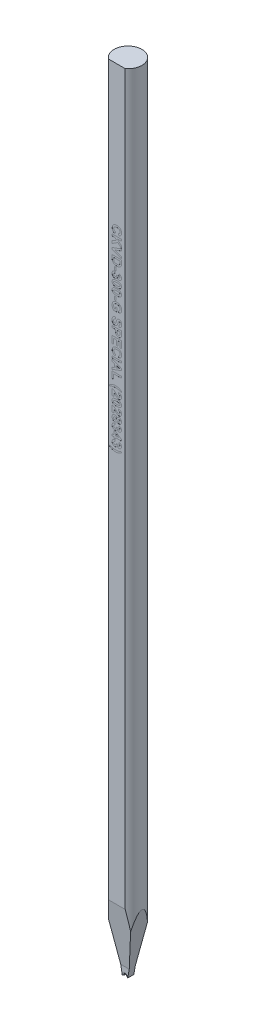
from build123d import *

# Parameters (mm, degrees)
SKETCH_TL_CUTTING_R       = 1.4986
TL_CUTTING_DEPTH          = 85.4964
SKETCH_TDF_GRINDING_W     = 3.0172
SKETCH_TDF_GRINDING_H     = 3.0172
TDF_GRINDING_DEPTH        = 86.522663762
SKETCH_ENGRAVING_W        = 0.166666667
SKETCH_ENGRAVING_H        = 0.371794872
SKETCH_ENGRAVING_W_2      = 1
SKETCH_ENGRAVING_H_2      = 0.192307693
ENGRAVING_DEPTH           = 0.005
VW_VR_GRINDING_DEPTH      = 1.5086
VW_VR_GRINDING_DEPTH_BACK = 1.5086
ISA_GRINDING_DEPTH        = 1.5086
ISA_GRINDING_DEPTH_BACK   = 1.5086
PRE_FRX_BRX_DEPTH         = 1.5086
PRE_FRX_BRX_DEPTH_BACK    = 1.5086
SKETCH_PRE_FRX_BRX_W      = 1.18348
SKETCH_PRE_FRX_BRX_H      = 0.89916
FR_EDM_R                  = 0.14986
BR_EDM_R                  = 0.14986
FA_BA_GRINDING_DEPTH      = 1.5086
FA_BA_GRINDING_DEPTH_BACK = 1.5086


with BuildPart() as part:
    # sketch_TL_cutting → TL_cutting (new body)
    with BuildSketch(Plane(origin=(0, 0, 0), x_dir=(1, 0, 0), z_dir=(0, 1, 0))):
        Circle(SKETCH_TL_CUTTING_R)
    extrude(amount=TL_CUTTING_DEPTH)

    # sketch_TDF_grinding → TDF_grinding (cut, through all)
    with BuildSketch(Plane(origin=(0, 0, 0), x_dir=(1, 0, 0), z_dir=(0, 1, 0))):
        with Locations((0, -2.71002)):
            Rectangle(SKETCH_TDF_GRINDING_W, SKETCH_TDF_GRINDING_H)
    extrude(amount=TDF_GRINDING_DEPTH, mode=Mode.SUBTRACT)

    # sketch_engraving → engraving (cut)
    # profile 1 of 26: a face of its own
    with BuildSketch(Plane.XY.offset(1.20142)):
        with BuildLine():
            Line((-0.128205128, 69.752810256), (-0.192307692, 69.560502564))
            add(Edge.make_bspline(
                [(-0.192307692, 69.560502564), (-0.204917923, 69.564409052), (-0.229612721, 69.572059184), (-0.2649877, 69.586137804), (-0.297871332, 69.602132008), (-0.328259475, 69.619959875), (-0.356049464, 69.639695258), (-0.381471598, 69.661189244), (-0.404368127, 69.684653424), (-0.424673345, 69.710070624), (-0.442633936, 69.737163711), (-0.457816548, 69.766256053), (-0.470893242, 69.79691117), (-0.481488041, 69.829440557), (-0.489972889, 69.863628151), (-0.495577171, 69.899634413), (-0.499377062, 69.937290896), (-0.499789062, 69.963003283), (-0.5, 69.976167628)],
                knots=[0, 0, 0, 0, 1.126670901, 2.206376047, 3.246533763, 4.245677351, 5.210506282, 6.152793389, 7.083980095, 8.004497442, 8.926231833, 9.854395169, 10.801995143, 11.768203916, 12.771938831, 13.805609698, 14.87650608, 16, 16, 16, 16], degree=3))
            add(Edge.make_bspline(
                [(-0.5, 69.976167628), (-0.499663994, 69.992416309), (-0.499003061, 70.024377949), (-0.492350465, 70.071119052), (-0.481969511, 70.115660328), (-0.467601869, 70.158069613), (-0.448555271, 70.198048786), (-0.42571373, 70.235973108), (-0.398318662, 70.271409391), (-0.367249987, 70.304550716), (-0.332452821, 70.334679196), (-0.294134751, 70.360672297), (-0.253074131, 70.383210491), (-0.208709772, 70.401136594), (-0.161353037, 70.415221791), (-0.110975156, 70.425068328), (-0.057578507, 70.431234942), (-0.020984357, 70.431937083), (-0.002203526, 70.432297436)],
                knots=[0, 0, 0, 0, 1.025134988, 2.016471176, 2.973446247, 3.909197306, 4.836872559, 5.763618465, 6.698581235, 7.658772073, 8.627106982, 9.597494692, 10.576422683, 11.578339294, 12.6118974, 13.690673505, 14.814808564, 16, 16, 16, 16], degree=3))
            add(Edge.make_bspline(
                [(-0.002203526, 70.432297436), (0.017576475, 70.4319292), (0.056163648, 70.431210839), (0.112313555, 70.425162878), (0.165084042, 70.415116768), (0.214577853, 70.401540058), (0.260470573, 70.383329249), (0.303160692, 70.361473909), (0.342311169, 70.335356152), (0.377833814, 70.305431091), (0.409480853, 70.272297852), (0.437377469, 70.236593428), (0.460593243, 70.198091041), (0.479896446, 70.157267336), (0.494630503, 70.113823397), (0.505304611, 70.067876602), (0.511505561, 70.019406054), (0.512376199, 69.98626808), (0.512820513, 69.969356731)],
                knots=[0, 0, 0, 0, 1.212773307, 2.365899439, 3.458117515, 4.504331001, 5.50806732, 6.480562534, 7.440239902, 8.387651817, 9.323121479, 10.245404239, 11.160468186, 12.07454208, 13.009500751, 13.96802424, 14.963018902, 16, 16, 16, 16], degree=3))
            add(Edge.make_bspline(
                [(0.512820513, 69.969356731), (0.512448361, 69.954587276), (0.511718707, 69.925629796), (0.506761415, 69.883224506), (0.498061698, 69.843036158), (0.486319015, 69.804847521), (0.470821797, 69.768875987), (0.451884357, 69.735057111), (0.429606892, 69.703274651), (0.412205553, 69.684125065), (0.403445513, 69.674484936)],
                knots=[0, 0, 0, 0, 1.098510076, 2.153775193, 3.169777012, 4.153122333, 5.120892526, 6.076995459, 7.031936742, 8, 8, 8, 8], degree=3))
            add(Edge.make_bspline(
                [(0.403445513, 69.674484936), (0.39787141, 69.668897644), (0.386592274, 69.657591818), (0.367549896, 69.642495368), (0.347050772, 69.628182058), (0.324745215, 69.614879068), (0.30046466, 69.603006849), (0.274581981, 69.591994097), (0.246997406, 69.581855069), (0.227800247, 69.576216604), (0.217948718, 69.573323077)],
                knots=[0, 0, 0, 0, 0.885292881, 1.791380647, 2.722937556, 3.69093542, 4.703306561, 5.754477758, 6.847650944, 8, 8, 8, 8], degree=3))
            Line((0.217948718, 69.573323077), (0.179487179, 69.765630769))
            add(Edge.make_bspline(
                [(0.179487179, 69.765630769), (0.1857949, 69.767265288), (0.198219456, 69.770484861), (0.21607256, 69.77699955), (0.233014714, 69.784471208), (0.248625569, 69.7937361), (0.263619506, 69.803562074), (0.277222328, 69.815224773), (0.290109132, 69.827729754), (0.301694454, 69.841618861), (0.312145605, 69.856493589), (0.321339918, 69.872203983), (0.329014435, 69.888788478), (0.335156827, 69.906121754), (0.340319842, 69.924145702), (0.34350638, 69.943032147), (0.345953545, 69.962615752), (0.3460861, 69.975958875), (0.346153846, 69.982778205)],
                knots=[0, 0, 0, 0, 1.051114734, 2.070420253, 3.064047898, 4.034553068, 4.997066449, 5.953344811, 6.921213386, 7.892675544, 8.867420182, 9.852654213, 10.826683617, 11.811917648, 12.818610352, 13.848120519, 14.900229319, 16, 16, 16, 16], degree=3))
            add(Edge.make_bspline(
                [(0.346153846, 69.982778205), (0.345958725, 69.992142256), (0.345576529, 70.01048423), (0.341532101, 70.03721448), (0.335695112, 70.062655692), (0.326982094, 70.08671706), (0.315677399, 70.109331698), (0.302244603, 70.130828905), (0.286035184, 70.150660806), (0.26758257, 70.169299764), (0.246135655, 70.186007721), (0.221779967, 70.200710652), (0.194212535, 70.212904121), (0.163711493, 70.222804409), (0.130202077, 70.230596736), (0.093641969, 70.236161162), (0.054005962, 70.239238434), (0.026581025, 70.239733903), (0.012419872, 70.239989744)],
                knots=[0, 0, 0, 0, 0.93816214, 1.837638998, 2.704791736, 3.551915875, 4.396257554, 5.235807848, 6.087970119, 6.959042444, 7.860386085, 8.80649345, 9.804409709, 10.875695391, 12.017327537, 13.250155505, 14.580089023, 16, 16, 16, 16], degree=3))
            add(Edge.make_bspline(
                [(0.012419872, 70.239989744), (-0.002609028, 70.239736423), (-0.031567402, 70.239248312), (-0.073337178, 70.236171685), (-0.111754322, 70.230571705), (-0.14688701, 70.222882849), (-0.178713725, 70.212932973), (-0.207179389, 70.200759106), (-0.23231734, 70.186286701), (-0.254110839, 70.169538275), (-0.272831387, 70.150937256), (-0.288926796, 70.130987439), (-0.302688307, 70.109806524), (-0.314010391, 70.087267053), (-0.322575422, 70.063283298), (-0.328786932, 70.038052371), (-0.332735688, 70.011481695), (-0.333131326, 69.993275799), (-0.333333333, 69.983980128)],
                knots=[0, 0, 0, 0, 1.475208372, 2.842499301, 4.107722225, 5.282836115, 6.369007568, 7.375918121, 8.315702116, 9.208439171, 10.065831443, 10.90006451, 11.71996243, 12.54067204, 13.369972975, 14.214060185, 15.088124569, 16, 16, 16, 16], degree=3))
            add(Edge.make_bspline(
                [(-0.333333333, 69.983980128), (-0.333161634, 69.977097953), (-0.332824013, 69.963565176), (-0.330681155, 69.943562689), (-0.326591822, 69.92436438), (-0.321184418, 69.905876281), (-0.314399721, 69.888026559), (-0.305696319, 69.87108748), (-0.295693052, 69.854725777), (-0.283969989, 69.83928094), (-0.270808612, 69.824546156), (-0.255597341, 69.811107159), (-0.238701667, 69.798641373), (-0.220008678, 69.787306947), (-0.199678377, 69.77672516), (-0.177394008, 69.767722121), (-0.153515697, 69.759334984), (-0.136789345, 69.755023153), (-0.128205128, 69.752810256)],
                knots=[0, 0, 0, 0, 0.980177776, 1.927374078, 2.859849964, 3.771585772, 4.668674471, 5.574490016, 6.479656464, 7.396337719, 8.332153134, 9.288470092, 10.28125149, 11.318486971, 12.398724812, 13.541284404, 14.738150009, 16, 16, 16, 16], degree=3))
        make_face()
    # profile 2 of 26: a face of its own
    with BuildSketch(Plane.XY.offset(1.20142)):
        Polygon((-0.5, 69.393835897), (0.5, 69.393835897), (0.5, 69.201528205), (0.052283654, 69.201528205), (0.5, 68.779853526), (0.5, 68.515630769), (0.11338141, 68.895438462), (-0.5, 68.502810256), (-0.5, 68.759020192), (-0.035456731, 69.041271795), (-0.198517628, 69.201528205), (-0.5, 69.201528205), align=None)
    # profile 3 of 26: a face of its own
    with BuildSketch(Plane.XY.offset(1.20142)):
        Polygon((-0.5, 68.126608333), (0.5, 68.4964), (0.5, 68.293275), (-0.243589744, 68.028451282), (0.5, 67.764629167), (0.5, 67.560502564), (-0.5, 67.928891987), align=None)
    # profile 4 of 26: a face of its own
    with BuildSketch(Plane.XY.offset(1.20142)):
        with BuildLine():
            Line((0.5, 67.470758974), (0.5, 67.103972115))
            add(Edge.make_bspline(
                [(0.5, 67.103972115), (0.500005193, 67.093954571), (0.500015306, 67.074448084), (0.498840892, 67.046139066), (0.497659587, 67.019666494), (0.495294873, 66.995106352), (0.492816233, 66.972373432), (0.489678088, 66.951426942), (0.485656212, 66.932399202), (0.482484481, 66.920400319), (0.480969551, 66.914669231)],
                knots=[0, 0, 0, 0, 1.259756885, 2.453039283, 3.563158368, 4.591894114, 5.55549294, 6.43918076, 7.254497783, 8, 8, 8, 8], degree=3))
            add(Edge.make_bspline(
                [(0.480969551, 66.914669231), (0.478637325, 66.907500254), (0.474014881, 66.893291431), (0.465827813, 66.872438378), (0.455960096, 66.852604479), (0.445111978, 66.833329819), (0.432903728, 66.815057553), (0.419595761, 66.797342873), (0.404753223, 66.780709803), (0.383633179, 66.75917514), (0.35420815, 66.734750255), (0.315375005, 66.70891972), (0.272594656, 66.687182014), (0.234409605, 66.671990641), (0.20183843, 66.661946542), (0.175754603, 66.655378141), (0.148301213, 66.649706468), (0.119383738, 66.645456292), (0.08913491, 66.641794906), (0.057465542, 66.639167238), (0.024383276, 66.63786625), (0.001870575, 66.637574494), (-0.009615385, 66.637425641)],
                knots=[0, 0, 0, 0, 0.745431882, 1.477436776, 2.212739876, 2.934276521, 3.663147754, 4.384200836, 5.123377481, 5.865761747, 7.365547505, 8.894711587, 10.468722596, 12.101948761, 12.951987285, 13.837595333, 14.760899389, 15.722756883, 16.726861385, 17.773652936, 18.864119771, 20, 20, 20, 20], degree=3))
            add(Edge.make_bspline(
                [(-0.009615385, 66.637425641), (-0.0294616, 66.637817046), (-0.067834928, 66.63857384), (-0.123301552, 66.644171211), (-0.17465514, 66.653466648), (-0.206804138, 66.663177075), (-0.222355769, 66.667874359)],
                knots=[0, 0, 0, 0, 1.103491527, 2.133638164, 3.0971734, 4, 4, 4, 4], degree=3))
            add(Edge.make_bspline(
                [(-0.222355769, 66.667874359), (-0.231274521, 66.671048003), (-0.248819098, 66.677291057), (-0.274127236, 66.688215932), (-0.298211673, 66.700020337), (-0.321053432, 66.712802184), (-0.342549771, 66.726626052), (-0.362636394, 66.741543645), (-0.381577746, 66.757323731), (-0.393236239, 66.76875549), (-0.399038462, 66.774444872)],
                knots=[0, 0, 0, 0, 1.090884612, 2.145940218, 3.175104604, 4.181306866, 5.161203701, 6.118658341, 7.063689906, 8, 8, 8, 8], degree=3))
            add(Edge.make_bspline(
                [(-0.399038462, 66.774444872), (-0.407300305, 66.783731145), (-0.424264154, 66.802798431), (-0.445652736, 66.83614995), (-0.464086504, 66.874025276), (-0.473760833, 66.901339168), (-0.478766026, 66.915470513)],
                knots=[0, 0, 0, 0, 0.912008655, 1.872605891, 2.89935344, 4, 4, 4, 4], degree=3))
            add(Edge.make_bspline(
                [(-0.478766026, 66.915470513), (-0.4805228, 66.921190486), (-0.484168894, 66.933061996), (-0.488062998, 66.951885444), (-0.492165475, 66.971979947), (-0.49463687, 66.993577223), (-0.497243066, 67.016453081), (-0.498706299, 67.040789822), (-0.49974511, 67.066503081), (-0.499913777, 67.084139175), (-0.5, 67.093154808)],
                knots=[0, 0, 0, 0, 0.799129865, 1.658552685, 2.566799617, 3.538529252, 4.561352959, 5.643373779, 6.795284424, 8, 8, 8, 8], degree=3))
            Line((-0.5, 67.093154808), (-0.5, 67.470758974))
            Line((-0.5, 67.470758974), (0.5, 67.470758974))
        make_face()
        with BuildLine():
            Line((0.333333333, 67.278451282), (-0.333333333, 67.278451282))
            Line((-0.333333333, 67.278451282), (-0.333333333, 67.120198077))
            add(Edge.make_bspline(
                [(-0.333333333, 67.120198077), (-0.333276671, 67.11305336), (-0.333167574, 67.099297049), (-0.332847006, 67.079391316), (-0.331979167, 67.061098115), (-0.331080228, 67.044321614), (-0.329595022, 67.02910549), (-0.328134266, 67.015383535), (-0.326090699, 67.003232132), (-0.324477534, 66.995727127), (-0.323717949, 66.992193269)],
                knots=[0, 0, 0, 0, 1.333384787, 2.567275092, 3.714769766, 4.750907381, 5.701951617, 6.567520054, 7.325492842, 8, 8, 8, 8], degree=3))
            add(Edge.make_bspline(
                [(-0.323717949, 66.992193269), (-0.321509316, 66.983916575), (-0.317207482, 66.967795757), (-0.307617456, 66.945160499), (-0.296048139, 66.924678507), (-0.282136533, 66.90600677), (-0.26455548, 66.88917967), (-0.242070693, 66.874815683), (-0.215254411, 66.861522192), (-0.189584523, 66.852418806), (-0.16665678, 66.845884413), (-0.147412959, 66.841461165), (-0.126593091, 66.837965591), (-0.104279343, 66.834958942), (-0.080500412, 66.832529499), (-0.055170426, 66.831017784), (-0.028320392, 66.829986029), (-0.009883527, 66.829819161), (-0.000400641, 66.829733333)],
                knots=[0, 0, 0, 0, 1.038686998, 2.023088296, 2.974059649, 3.888265163, 4.839857954, 5.909819677, 7.113156087, 8.466843969, 9.20827164, 10.006482943, 10.861893492, 11.769681931, 12.739021491, 13.762258324, 14.849031541, 16, 16, 16, 16], degree=3))
            add(Edge.make_bspline(
                [(-0.000400641, 66.829733333), (0.009082275, 66.8298185), (0.027452469, 66.829983485), (0.054102292, 66.831013664), (0.079033415, 66.832516863), (0.102276578, 66.834963691), (0.123864169, 66.837923456), (0.143813574, 66.841460891), (0.161996804, 66.845854423), (0.183589283, 66.852407511), (0.207947697, 66.862244996), (0.23429421, 66.876071199), (0.2571147, 66.892336402), (0.276689574, 66.910691558), (0.29287817, 66.931778569), (0.306422028, 66.955149371), (0.316938162, 66.981280279), (0.321416742, 66.999869318), (0.323717949, 67.009420833)],
                knots=[0, 0, 0, 0, 1.118059345, 2.165891593, 3.144157881, 4.062285166, 4.920717571, 5.712910489, 6.449981617, 7.12489426, 8.371943983, 9.541298068, 10.624898781, 11.666293176, 12.69306237, 13.747704633, 14.842713931, 16, 16, 16, 16], degree=3))
            add(Edge.make_bspline(
                [(0.323717949, 67.009420833), (0.324486218, 67.013555143), (0.326177652, 67.022657311), (0.328151987, 67.037761571), (0.329628909, 67.055548179), (0.331099472, 67.075977116), (0.331977905, 67.099027064), (0.332859431, 67.124732571), (0.333166326, 67.153116851), (0.333276065, 67.172949207), (0.333333333, 67.183299038)],
                knots=[0, 0, 0, 0, 0.578739524, 1.274162912, 2.095457587, 3.035141998, 4.093102578, 5.270121571, 6.575369351, 8, 8, 8, 8], degree=3))
            Line((0.333333333, 67.183299038), (0.333333333, 67.278451282))
        make_face(mode=Mode.SUBTRACT)
    # profile 5 of 26: a face of its own
    with BuildSketch(Plane.XY.offset(1.20142)):
        with Locations((-0.147435898, 66.310502564)):
            Rectangle(SKETCH_ENGRAVING_W, SKETCH_ENGRAVING_H)
    # profile 6 of 26: a face of its own
    with BuildSketch(Plane.XY.offset(1.20142)):
        with BuildLine():
            Line((-0.215945513, 66.060502564), (-0.192307692, 65.868194872))
            add(Edge.make_bspline(
                [(-0.192307692, 65.868194872), (-0.204132194, 65.866534047), (-0.226576764, 65.863381568), (-0.25764429, 65.853552911), (-0.284674848, 65.840719233), (-0.306838708, 65.823737778), (-0.324372016, 65.80411589), (-0.33711688, 65.78229994), (-0.34490548, 65.758267347), (-0.345732378, 65.741516439), (-0.346153846, 65.732978526)],
                knots=[0, 0, 0, 0, 1.266221457, 2.403466716, 3.446976871, 4.428566981, 5.347951143, 6.225000641, 7.095285456, 8, 8, 8, 8], degree=3))
            add(Edge.make_bspline(
                [(-0.346153846, 65.732978526), (-0.346055611, 65.728363461), (-0.345861023, 65.719221738), (-0.343788926, 65.705789506), (-0.340465357, 65.692918943), (-0.335437029, 65.680731108), (-0.329556159, 65.668986661), (-0.32227181, 65.657736899), (-0.313281658, 65.647422443), (-0.303428531, 65.637359798), (-0.292217285, 65.628428114), (-0.280052259, 65.620560902), (-0.267055651, 65.613654907), (-0.252891939, 65.608302089), (-0.237868043, 65.604112024), (-0.221918716, 65.601116531), (-0.205104086, 65.599293476), (-0.193581061, 65.599075398), (-0.187700321, 65.598964103)],
                knots=[0, 0, 0, 0, 0.951793398, 1.885354025, 2.797928458, 3.688489604, 4.600647717, 5.506538063, 6.445271935, 7.419741996, 8.409776722, 9.395967385, 10.406883209, 11.440832221, 12.514165763, 13.622322902, 14.786559767, 16, 16, 16, 16], degree=3))
            add(Edge.make_bspline(
                [(-0.187700321, 65.598964103), (-0.176786947, 65.599382422), (-0.155968497, 65.600180413), (-0.126418152, 65.606306809), (-0.100528778, 65.617013017), (-0.078485293, 65.631691647), (-0.060832569, 65.649480913), (-0.047691388, 65.669490944), (-0.040013472, 65.691714606), (-0.038982665, 65.707147528), (-0.038461538, 65.714949679)],
                knots=[0, 0, 0, 0, 1.241181749, 2.367689556, 3.413199457, 4.409869786, 5.360751057, 6.245864667, 7.113192516, 8, 8, 8, 8], degree=3))
            add(Edge.make_bspline(
                [(-0.038461538, 65.714949679), (-0.038603641, 65.720503112), (-0.038904883, 65.732275803), (-0.04203482, 65.750587586), (-0.046354275, 65.770556665), (-0.050509304, 65.78415409), (-0.052684295, 65.791271795)],
                knots=[0, 0, 0, 0, 0.854525515, 1.811503923, 2.854410343, 4, 4, 4, 4], degree=3))
            Line((-0.052684295, 65.791271795), (0.102564103, 65.773242949))
            add(Edge.make_bspline(
                [(0.102564103, 65.773242949), (0.102472429, 65.767898846), (0.102294537, 65.757528639), (0.103550083, 65.742385032), (0.10584242, 65.72821013), (0.10956176, 65.715037094), (0.114073964, 65.702853353), (0.119743619, 65.69155343), (0.126797738, 65.681409885), (0.137452935, 65.669074156), (0.153346669, 65.656372172), (0.175381237, 65.645319273), (0.200195104, 65.638563806), (0.217704887, 65.637813684), (0.226762821, 65.637425641)],
                knots=[0, 0, 0, 0, 0.916921599, 1.779281976, 2.604591006, 3.377627834, 4.124827521, 4.832199257, 5.541147775, 6.239830602, 7.625300353, 8.999010263, 10.447566839, 12, 12, 12, 12], degree=3))
            add(Edge.make_bspline(
                [(0.226762821, 65.637425641), (0.234476764, 65.637676334), (0.249283176, 65.638157523), (0.270180788, 65.643395916), (0.288882255, 65.651270608), (0.304586758, 65.662898575), (0.317487731, 65.677054609), (0.326781862, 65.693694939), (0.332438867, 65.712588834), (0.333026806, 65.725859453), (0.333333333, 65.732778205)],
                knots=[0, 0, 0, 0, 1.147344735, 2.202253707, 3.191599761, 4.153119954, 5.090433954, 6.026214277, 6.97094964, 8, 8, 8, 8], degree=3))
            add(Edge.make_bspline(
                [(0.333333333, 65.732778205), (0.332987648, 65.739708214), (0.332308151, 65.753330209), (0.325708071, 65.772798134), (0.315274673, 65.790641507), (0.300599014, 65.806510612), (0.282168696, 65.820209405), (0.259890756, 65.831166627), (0.233746812, 65.838598565), (0.214986903, 65.841191309), (0.205128205, 65.842553846)],
                knots=[0, 0, 0, 0, 0.89036141, 1.750142028, 2.61780756, 3.537452052, 4.514848764, 5.561443886, 6.71849122, 8, 8, 8, 8], degree=3))
            Line((0.205128205, 65.842553846), (0.233974359, 66.034861538))
            add(Edge.make_bspline(
                [(0.233974359, 66.034861538), (0.248657574, 66.031692323), (0.276764536, 66.025625734), (0.316129698, 66.013201503), (0.350961973, 65.998711687), (0.381387831, 65.981441655), (0.408215463, 65.961335814), (0.431647434, 65.93761335), (0.452006068, 65.91028244), (0.469141566, 65.879607941), (0.48286138, 65.846238807), (0.493019554, 65.810730657), (0.49884023, 65.773168376), (0.49960808, 65.747488246), (0.5, 65.734380769)],
                knots=[0, 0, 0, 0, 1.22092895, 2.337131514, 3.351677773, 4.283094182, 5.174661873, 6.069250129, 6.984703325, 7.937694494, 8.918809374, 9.912257166, 10.934388599, 12, 12, 12, 12], degree=3))
            add(Edge.make_bspline(
                [(0.5, 65.734380769), (0.499743324, 65.7232156), (0.499240363, 65.701337211), (0.494922998, 65.669342302), (0.487994845, 65.638986892), (0.478138042, 65.610372682), (0.465473847, 65.583430657), (0.449646388, 65.558407035), (0.431514029, 65.53466228), (0.417247021, 65.520676666), (0.41005609, 65.513627564)],
                knots=[0, 0, 0, 0, 1.090586174, 2.137027055, 3.148380755, 4.128502444, 5.088724121, 6.050075692, 7.017189, 8, 8, 8, 8], degree=3))
            add(Edge.make_bspline(
                [(0.41005609, 65.513627564), (0.403937931, 65.508174347), (0.391853934, 65.497403677), (0.372464834, 65.483452563), (0.352400741, 65.471665213), (0.33177098, 65.462111955), (0.310637907, 65.454351566), (0.288816497, 65.448944728), (0.26639464, 65.445649626), (0.251213033, 65.445295679), (0.243589744, 65.445117949)],
                knots=[0, 0, 0, 0, 1.065686435, 2.104841259, 3.101590809, 4.088754543, 5.058798532, 6.025881737, 7.008716709, 8, 8, 8, 8], degree=3))
            add(Edge.make_bspline(
                [(0.243589744, 65.445117949), (0.232867144, 65.445508156), (0.211730927, 65.446277325), (0.180999661, 65.45338324), (0.151856431, 65.4647029), (0.124562561, 65.480757174), (0.09868881, 65.500990588), (0.075169415, 65.526316452), (0.052695262, 65.555562269), (0.04001359, 65.577565891), (0.033453526, 65.588948077)],
                knots=[0, 0, 0, 0, 0.957658001, 1.887720032, 2.804751961, 3.743912922, 4.709136476, 5.731252806, 6.826406682, 8, 8, 8, 8], degree=3))
            add(Edge.make_bspline(
                [(0.033453526, 65.588948077), (0.031822372, 65.582175609), (0.028603533, 65.568811152), (0.022022537, 65.549514744), (0.01367829, 65.531457672), (0.004232675, 65.514275623), (-0.006542103, 65.498065765), (-0.018789165, 65.482873779), (-0.032819972, 65.469156037), (-0.047679673, 65.456052996), (-0.063887586, 65.444503284), (-0.081022983, 65.434471663), (-0.098866636, 65.425786197), (-0.117582182, 65.418774095), (-0.137087229, 65.413333972), (-0.157475267, 65.409606248), (-0.178623511, 65.407093745), (-0.193034825, 65.406803264), (-0.200320513, 65.40665641)],
                knots=[0, 0, 0, 0, 1.03751577, 2.047382676, 3.031239205, 3.997486026, 4.965932412, 5.927662117, 6.898405035, 7.88572577, 8.876798211, 9.857834218, 10.841137353, 11.829660183, 12.831310853, 13.853692922, 14.91492721, 16, 16, 16, 16], degree=3))
            add(Edge.make_bspline(
                [(-0.200320513, 65.40665641), (-0.2109584, 65.406872661), (-0.231937745, 65.407299137), (-0.2626715, 65.412274881), (-0.292387684, 65.419227328), (-0.320688592, 65.429885264), (-0.348018602, 65.443044593), (-0.373770643, 65.459712865), (-0.398719241, 65.478775045), (-0.421838487, 65.500951285), (-0.443209677, 65.52508231), (-0.461662849, 65.551183574), (-0.477734226, 65.578462651), (-0.490419897, 65.607447217), (-0.500667813, 65.637701873), (-0.507459472, 65.669576996), (-0.512114414, 65.702793455), (-0.512582989, 65.725483302), (-0.512820513, 65.736984936)],
                knots=[0, 0, 0, 0, 1.00633359, 1.984625146, 2.941575753, 3.891818189, 4.841976474, 5.80848851, 6.791183869, 7.810935832, 8.837000052, 9.838854168, 10.83333837, 11.829730352, 12.829487178, 13.852742075, 14.911540725, 16, 16, 16, 16], degree=3))
            add(Edge.make_bspline(
                [(-0.512820513, 65.736984936), (-0.512637793, 65.747883744), (-0.51227889, 65.76929157), (-0.508027091, 65.800630842), (-0.501772194, 65.830646869), (-0.492621954, 65.85916445), (-0.481351422, 65.886431997), (-0.466822586, 65.911934845), (-0.450309361, 65.936329476), (-0.430965435, 65.958818893), (-0.409882535, 65.979729186), (-0.386697234, 65.998096375), (-0.362149526, 66.014463988), (-0.336021778, 66.028541702), (-0.308246096, 66.040211545), (-0.278894175, 66.049298132), (-0.248055897, 66.05654486), (-0.226796469, 66.05916515), (-0.215945513, 66.060502564)],
                knots=[0, 0, 0, 0, 1.077528213, 2.11651914, 3.123276654, 4.10732375, 5.075386463, 6.036572488, 7.005896639, 7.98540975, 8.966414275, 9.939311093, 10.906719916, 11.882103104, 12.870994428, 13.882228509, 14.919075059, 16, 16, 16, 16], degree=3))
        make_face()
    # profile 7 of 26: a face of its own
    with BuildSketch(Plane.XY.offset(1.20142)):
        with BuildLine():
            add(Edge.make_bspline(
                [(0.5, 64.964348718), (0.49971384, 64.952444998), (0.499156721, 64.929269821), (0.494192381, 64.895507508), (0.486315205, 64.863754925), (0.474936732, 64.834005943), (0.460535804, 64.806109267), (0.442472771, 64.780457415), (0.421624591, 64.75645643), (0.405435577, 64.742600797), (0.397235577, 64.735582692)],
                knots=[0, 0, 0, 0, 1.098626248, 2.138899374, 3.143835643, 4.113754749, 5.073488057, 6.034745239, 7.004566348, 8, 8, 8, 8], degree=3))
            add(Edge.make_bspline(
                [(0.397235577, 64.735582692), (0.392013767, 64.731567993), (0.381356969, 64.723374695), (0.364136726, 64.71234029), (0.345869985, 64.701731685), (0.326116385, 64.692473442), (0.305221356, 64.683600078), (0.283126793, 64.675409313), (0.259707844, 64.66817695), (0.235071142, 64.661872124), (0.209179241, 64.655978627), (0.181968999, 64.651041398), (0.15350924, 64.646815972), (0.123831018, 64.643520738), (0.092992495, 64.640566339), (0.060842825, 64.638949757), (0.027454838, 64.637625267), (0.004742429, 64.637492949), (-0.006810897, 64.637425641)],
                knots=[0, 0, 0, 0, 0.746775751, 1.524038446, 2.317840886, 3.141016509, 3.996283186, 4.892488336, 5.812382473, 6.774967264, 7.776368117, 8.823659909, 9.910833035, 11.039122168, 12.210293276, 13.424012874, 14.68964937, 16, 16, 16, 16], degree=3))
            add(Edge.make_bspline(
                [(-0.006810897, 64.637425641), (-0.01836425, 64.637491934), (-0.041009977, 64.637621876), (-0.074330982, 64.638954693), (-0.106413621, 64.640567781), (-0.13725379, 64.643513853), (-0.166926114, 64.646840728), (-0.195353975, 64.650946272), (-0.22243919, 64.656264764), (-0.248289812, 64.662071418), (-0.27303117, 64.668336077), (-0.296407841, 64.6758899), (-0.318777777, 64.683750303), (-0.339699687, 64.692829898), (-0.359477735, 64.702420372), (-0.377930928, 64.712871112), (-0.395257891, 64.724028726), (-0.40597091, 64.732301289), (-0.411258013, 64.736383974)],
                knots=[0, 0, 0, 0, 1.308411734, 2.564617834, 3.776541518, 4.94597967, 6.0725993, 7.15816376, 8.197872509, 9.197791611, 10.158952087, 11.086962723, 11.979249638, 12.843171697, 13.668427753, 14.467630577, 15.243743175, 16, 16, 16, 16], degree=3))
            add(Edge.make_bspline(
                [(-0.411258013, 64.736383974), (-0.419387722, 64.743337875), (-0.435436162, 64.757065209), (-0.456111536, 64.780800465), (-0.473801555, 64.8064109), (-0.487914093, 64.834257064), (-0.499368982, 64.863861236), (-0.506993451, 64.895665546), (-0.511967929, 64.929335616), (-0.512532265, 64.952511213), (-0.512820513, 64.964348718)],
                knots=[0, 0, 0, 0, 0.991667276, 1.957599061, 2.911530233, 3.873218945, 4.847995157, 5.850445929, 6.902062539, 8, 8, 8, 8], degree=3))
            add(Edge.make_bspline(
                [(-0.512820513, 64.964348718), (-0.512476011, 64.976321133), (-0.511800941, 64.999781702), (-0.506449472, 65.034035149), (-0.497876451, 65.066594622), (-0.485636462, 65.097343234), (-0.469774335, 65.126236989), (-0.45076002, 65.153501616), (-0.427732542, 65.178543948), (-0.40629523, 65.198149361), (-0.386925042, 65.212492741), (-0.37086259, 65.222609036), (-0.353675124, 65.232385358), (-0.33482528, 65.240823499), (-0.314870578, 65.249148475), (-0.293380967, 65.256521787), (-0.270541238, 65.263026959), (-0.246455682, 65.269134901), (-0.220958398, 65.274228025), (-0.194124629, 65.278912952), (-0.165840258, 65.282604927), (-0.136262825, 65.285878243), (-0.105322509, 65.288182844), (-0.073069943, 65.290054475), (-0.039401887, 65.290992969), (-0.01649349, 65.291177608), (-0.004807692, 65.291271795)],
                knots=[0, 0, 0, 0, 1.257818097, 2.464759732, 3.634271214, 4.790227596, 5.933394726, 7.09190477, 8.274482889, 9.50191983, 10.139172818, 10.805000628, 11.49619854, 12.215266328, 12.973768034, 13.768328009, 14.601232062, 15.469317089, 16.379095881, 17.333267023, 18.331755967, 19.376479622, 20.460535752, 21.592206075, 22.771760786, 24, 24, 24, 24], degree=3))
            add(Edge.make_bspline(
                [(-0.004807692, 65.291271795), (0.006678925, 65.291206), (0.02919122, 65.291077052), (0.062378132, 65.289734948), (0.094328674, 65.288141634), (0.12509981, 65.28516902), (0.154640959, 65.281869515), (0.183004063, 65.277756894), (0.209982531, 65.272338814), (0.235876189, 65.266989743), (0.260431507, 65.260249782), (0.2837906, 65.252824475), (0.306110518, 65.244990136), (0.326924245, 65.235817854), (0.346659803, 65.226282898), (0.365109758, 65.215824838), (0.382437536, 65.204669066), (0.39315045, 65.196396265), (0.3984375, 65.192313462)],
                knots=[0, 0, 0, 0, 1.304443357, 2.556541329, 3.771813033, 4.936929721, 6.066661712, 7.147723817, 8.190304831, 9.191350322, 10.149780912, 11.080355239, 11.975107155, 12.834450748, 13.66198663, 14.463397305, 15.241653965, 16, 16, 16, 16], degree=3))
            add(Edge.make_bspline(
                [(0.3984375, 65.192313462), (0.406566428, 65.185359179), (0.422613323, 65.171631089), (0.443299998, 65.147901361), (0.460913987, 65.122319209), (0.475197493, 65.094554301), (0.486497465, 65.064882107), (0.494183265, 65.033036121), (0.499144648, 64.999360686), (0.499710816, 64.976185839), (0.5, 64.964348718)],
                knots=[0, 0, 0, 0, 0.991631672, 1.957528776, 2.911425699, 3.867574088, 4.848108326, 5.850523106, 6.902101959, 8, 8, 8, 8], degree=3))
        make_face()
        with BuildLine():
            add(Edge.make_bspline(
                [(0.333333333, 64.964348718), (0.333068079, 64.970516684), (0.332548986, 64.982587158), (0.328316127, 65.000142094), (0.321759633, 65.016723165), (0.312130705, 65.032281206), (0.299093083, 65.04668978), (0.281476094, 65.058897658), (0.259881539, 65.069451162), (0.243736, 65.074730771), (0.235176282, 65.077529808)],
                knots=[0, 0, 0, 0, 0.909107913, 1.77908945, 2.650019014, 3.530482969, 4.465025013, 5.495890128, 6.672421267, 8, 8, 8, 8], degree=3))
            add(Edge.make_bspline(
                [(0.235176282, 65.077529808), (0.228718042, 65.079277997), (0.214837576, 65.083035317), (0.192206647, 65.08729972), (0.166522939, 65.090816485), (0.137792419, 65.093786038), (0.105999886, 65.096202628), (0.071125109, 65.097690848), (0.033192525, 65.098719478), (0.006878451, 65.098880391), (-0.006810897, 65.098964103)],
                knots=[0, 0, 0, 0, 0.658986521, 1.416336438, 2.266694271, 3.212608458, 4.261595115, 5.407496572, 6.651304179, 8, 8, 8, 8], degree=3))
            add(Edge.make_bspline(
                [(-0.006810897, 65.098964103), (-0.020433943, 65.098973117), (-0.046549094, 65.098990397), (-0.084006477, 65.097816163), (-0.118154033, 65.09664872), (-0.148991056, 65.094279061), (-0.176626244, 65.091940892), (-0.200847568, 65.088403343), (-0.221857789, 65.084850608), (-0.244486895, 65.078817153), (-0.268257705, 65.070501394), (-0.292448985, 65.059272977), (-0.311537375, 65.046607058), (-0.325415776, 65.032075587), (-0.334597404, 65.016330329), (-0.341538269, 65.000026395), (-0.345246665, 64.982474555), (-0.345848983, 64.970440013), (-0.346153846, 64.964348718)],
                knots=[0, 0, 0, 0, 1.613038927, 3.092168624, 4.43749063, 5.658264602, 6.75425577, 7.720394221, 8.556328411, 9.275513998, 10.490872946, 11.534172084, 12.42681833, 13.187531851, 13.88996177, 14.574222125, 15.278341114, 16, 16, 16, 16], degree=3))
            add(Edge.make_bspline(
                [(-0.346153846, 64.964348718), (-0.345874419, 64.95825088), (-0.345321688, 64.946188799), (-0.341225408, 64.928656833), (-0.334465655, 64.912099336), (-0.325029126, 64.896436493), (-0.311901617, 64.88201441), (-0.294300445, 64.869797614), (-0.272700888, 64.85924693), (-0.25655611, 64.853966893), (-0.247996795, 64.851167628)],
                knots=[0, 0, 0, 0, 0.899391665, 1.779078861, 2.640979247, 3.529945348, 4.464599804, 5.495588918, 6.672261578, 8, 8, 8, 8], degree=3))
            add(Edge.make_bspline(
                [(-0.247996795, 64.851167628), (-0.241538043, 64.849421968), (-0.227719754, 64.845687186), (-0.205229709, 64.841392396), (-0.179679092, 64.83786611), (-0.151079269, 64.834924791), (-0.11935541, 64.832484431), (-0.084546407, 64.831008845), (-0.046680798, 64.829979247), (-0.020433482, 64.829817356), (-0.006810897, 64.829733333)],
                knots=[0, 0, 0, 0, 0.66114423, 1.414496391, 2.261103113, 3.210114492, 4.255954433, 5.405607896, 6.653488082, 8, 8, 8, 8], degree=3))
            add(Edge.make_bspline(
                [(-0.006810897, 64.829733333), (0.006810741, 64.829847109), (0.032921137, 64.830065199), (0.070464093, 64.830692091), (0.104645163, 64.832447006), (0.13553417, 64.834203226), (0.163028833, 64.837168631), (0.187277888, 64.840111537), (0.208178651, 64.844183667), (0.23096624, 64.849775697), (0.254848985, 64.85811368), (0.278913284, 64.86968584), (0.298191428, 64.88212291), (0.312146257, 64.896629879), (0.321683592, 64.912348044), (0.328364426, 64.928800374), (0.332523972, 64.946249531), (0.333060584, 64.95824941), (0.333333333, 64.964348718)],
                knots=[0, 0, 0, 0, 1.611458614, 3.088895909, 4.441089836, 5.660086535, 6.747875232, 7.711965119, 8.548505902, 9.26500436, 10.486583113, 11.532259092, 12.419544583, 13.184925779, 13.890764661, 14.581638641, 15.279074115, 16, 16, 16, 16], degree=3))
        make_face(mode=Mode.SUBTRACT)
    # profile 8 of 26: a face of its own
    with BuildSketch(Plane.XY.offset(1.20142)):
        with BuildLine():
            add(Edge.make_bspline(
                [(0.5, 64.195117949), (0.49971384, 64.183214229), (0.499156721, 64.160039051), (0.494192381, 64.126276739), (0.486315205, 64.094524156), (0.474936732, 64.064775173), (0.460535804, 64.036878497), (0.442472771, 64.011226646), (0.421624591, 63.987225661), (0.405435577, 63.973370028), (0.397235577, 63.966351923)],
                knots=[0, 0, 0, 0, 1.098626248, 2.138899374, 3.143835643, 4.113754749, 5.073488057, 6.034745239, 7.004566348, 8, 8, 8, 8], degree=3))
            add(Edge.make_bspline(
                [(0.397235577, 63.966351923), (0.392013767, 63.962337224), (0.381356969, 63.954143926), (0.364136726, 63.94310952), (0.345869985, 63.932500915), (0.326116385, 63.923242673), (0.305221356, 63.914369309), (0.283126793, 63.906178544), (0.259707844, 63.89894618), (0.235071142, 63.892641354), (0.209179241, 63.886747858), (0.181968999, 63.881810628), (0.15350924, 63.877585203), (0.123831018, 63.874289969), (0.092992495, 63.87133557), (0.060842825, 63.869718988), (0.027454838, 63.868394498), (0.004742429, 63.868262179), (-0.006810897, 63.868194872)],
                knots=[0, 0, 0, 0, 0.746775751, 1.524038446, 2.317840886, 3.141016509, 3.996283186, 4.892488336, 5.812382473, 6.774967264, 7.776368117, 8.823659909, 9.910833035, 11.039122168, 12.210293276, 13.424012874, 14.68964937, 16, 16, 16, 16], degree=3))
            add(Edge.make_bspline(
                [(-0.006810897, 63.868194872), (-0.01836425, 63.868261165), (-0.041009977, 63.868391107), (-0.074330982, 63.869723924), (-0.106413621, 63.871337012), (-0.13725379, 63.874283084), (-0.166926114, 63.877609959), (-0.195353975, 63.881715503), (-0.22243919, 63.887033995), (-0.248289812, 63.892840649), (-0.27303117, 63.899105308), (-0.296407841, 63.906659131), (-0.318777777, 63.914519533), (-0.339699687, 63.923599129), (-0.359477735, 63.933189602), (-0.377930928, 63.943640342), (-0.395257891, 63.954797957), (-0.40597091, 63.96307052), (-0.411258013, 63.967153205)],
                knots=[0, 0, 0, 0, 1.308411734, 2.564617834, 3.776541518, 4.94597967, 6.0725993, 7.15816376, 8.197872509, 9.197791611, 10.158952087, 11.086962723, 11.979249638, 12.843171697, 13.668427753, 14.467630577, 15.243743175, 16, 16, 16, 16], degree=3))
            add(Edge.make_bspline(
                [(-0.411258013, 63.967153205), (-0.419387722, 63.974107105), (-0.435436162, 63.98783444), (-0.456111536, 64.011569695), (-0.473801555, 64.037180131), (-0.487914093, 64.065026295), (-0.499368982, 64.094630467), (-0.506993451, 64.126434777), (-0.511967929, 64.160104847), (-0.512532265, 64.183280444), (-0.512820513, 64.195117949)],
                knots=[0, 0, 0, 0, 0.991667276, 1.957599061, 2.911530233, 3.873218945, 4.847995157, 5.850445929, 6.902062539, 8, 8, 8, 8], degree=3))
            add(Edge.make_bspline(
                [(-0.512820513, 64.195117949), (-0.512476011, 64.207090364), (-0.511800941, 64.230550933), (-0.506449472, 64.264804379), (-0.497876451, 64.297363853), (-0.485636462, 64.328112465), (-0.469774335, 64.35700622), (-0.45076002, 64.384270847), (-0.427732542, 64.409313179), (-0.40629523, 64.428918592), (-0.386925042, 64.443261971), (-0.37086259, 64.453378267), (-0.353675124, 64.463154589), (-0.33482528, 64.47159273), (-0.314870578, 64.479917706), (-0.293380967, 64.487291018), (-0.270541238, 64.49379619), (-0.246455682, 64.499904132), (-0.220958398, 64.504997256), (-0.194124629, 64.509682183), (-0.165840258, 64.513374157), (-0.136262825, 64.516647473), (-0.105322509, 64.518952075), (-0.073069943, 64.520823706), (-0.039401887, 64.5217622), (-0.01649349, 64.521946839), (-0.004807692, 64.522041026)],
                knots=[0, 0, 0, 0, 1.257818097, 2.464759732, 3.634271214, 4.790227596, 5.933394726, 7.09190477, 8.274482889, 9.50191983, 10.139172818, 10.805000628, 11.49619854, 12.215266328, 12.973768034, 13.768328009, 14.601232062, 15.469317089, 16.379095881, 17.333267023, 18.331755967, 19.376479622, 20.460535752, 21.592206075, 22.771760786, 24, 24, 24, 24], degree=3))
            add(Edge.make_bspline(
                [(-0.004807692, 64.522041026), (0.006678925, 64.521975231), (0.02919122, 64.521846282), (0.062378132, 64.520504179), (0.094328674, 64.518910865), (0.12509981, 64.515938251), (0.154640959, 64.512638746), (0.183004063, 64.508526125), (0.209982531, 64.503108045), (0.235876189, 64.497758974), (0.260431507, 64.491019013), (0.2837906, 64.483593706), (0.306110518, 64.475759367), (0.326924245, 64.466587084), (0.346659803, 64.457052128), (0.365109758, 64.446594069), (0.382437536, 64.435438297), (0.39315045, 64.427165495), (0.3984375, 64.423082692)],
                knots=[0, 0, 0, 0, 1.304443357, 2.556541329, 3.771813033, 4.936929721, 6.066661712, 7.147723817, 8.190304831, 9.191350322, 10.149780912, 11.080355239, 11.975107155, 12.834450748, 13.66198663, 14.463397305, 15.241653965, 16, 16, 16, 16], degree=3))
            add(Edge.make_bspline(
                [(0.3984375, 64.423082692), (0.406566428, 64.41612841), (0.422613323, 64.40240032), (0.443299998, 64.378670592), (0.460913987, 64.353088439), (0.475197493, 64.325323532), (0.486497465, 64.295651338), (0.494183265, 64.263805352), (0.499144648, 64.230129916), (0.499710816, 64.20695507), (0.5, 64.195117949)],
                knots=[0, 0, 0, 0, 0.991631672, 1.957528776, 2.911425699, 3.867574088, 4.848108326, 5.850523106, 6.902101959, 8, 8, 8, 8], degree=3))
        make_face()
        with BuildLine():
            add(Edge.make_bspline(
                [(0.333333333, 64.195117949), (0.333068079, 64.201285915), (0.332548986, 64.213356389), (0.328316127, 64.230911325), (0.321759633, 64.247492396), (0.312130705, 64.263050436), (0.299093083, 64.277459011), (0.281476094, 64.289666888), (0.259881539, 64.300220392), (0.243736, 64.305500001), (0.235176282, 64.308299038)],
                knots=[0, 0, 0, 0, 0.909107913, 1.77908945, 2.650019014, 3.530482969, 4.465025013, 5.495890128, 6.672421267, 8, 8, 8, 8], degree=3))
            add(Edge.make_bspline(
                [(0.235176282, 64.308299038), (0.228718042, 64.310047227), (0.214837576, 64.313804548), (0.192206647, 64.318068951), (0.166522939, 64.321585716), (0.137792419, 64.324555269), (0.105999886, 64.326971859), (0.071125109, 64.328460078), (0.033192525, 64.329488709), (0.006878451, 64.329649622), (-0.006810897, 64.329733333)],
                knots=[0, 0, 0, 0, 0.658986521, 1.416336438, 2.266694271, 3.212608458, 4.261595115, 5.407496572, 6.651304179, 8, 8, 8, 8], degree=3))
            add(Edge.make_bspline(
                [(-0.006810897, 64.329733333), (-0.020433943, 64.329742347), (-0.046549094, 64.329759627), (-0.084006477, 64.328585394), (-0.118154033, 64.327417951), (-0.148991056, 64.325048292), (-0.176626244, 64.322710123), (-0.200847568, 64.319172574), (-0.221857789, 64.315619839), (-0.244486895, 64.309586384), (-0.268257705, 64.301270625), (-0.292448985, 64.290042207), (-0.311537375, 64.277376289), (-0.325415776, 64.262844818), (-0.334597404, 64.24709956), (-0.341538269, 64.230795625), (-0.345246665, 64.213243786), (-0.345848983, 64.201209244), (-0.346153846, 64.195117949)],
                knots=[0, 0, 0, 0, 1.613038927, 3.092168624, 4.43749063, 5.658264602, 6.75425577, 7.720394221, 8.556328411, 9.275513998, 10.490872946, 11.534172084, 12.42681833, 13.187531851, 13.88996177, 14.574222125, 15.278341114, 16, 16, 16, 16], degree=3))
            add(Edge.make_bspline(
                [(-0.346153846, 64.195117949), (-0.345874419, 64.189020111), (-0.345321688, 64.17695803), (-0.341225408, 64.159426063), (-0.334465655, 64.142868567), (-0.325029126, 64.127205723), (-0.311901617, 64.112783641), (-0.294300445, 64.100566845), (-0.272700888, 64.090016161), (-0.25655611, 64.084736123), (-0.247996795, 64.081936859)],
                knots=[0, 0, 0, 0, 0.899391665, 1.779078861, 2.640979247, 3.529945348, 4.464599804, 5.495588918, 6.672261578, 8, 8, 8, 8], degree=3))
            add(Edge.make_bspline(
                [(-0.247996795, 64.081936859), (-0.241538043, 64.080191199), (-0.227719754, 64.076456417), (-0.205229709, 64.072161627), (-0.179679092, 64.06863534), (-0.151079269, 64.065694022), (-0.11935541, 64.063253662), (-0.084546407, 64.061778076), (-0.046680798, 64.060748478), (-0.020433482, 64.060586587), (-0.006810897, 64.060502564)],
                knots=[0, 0, 0, 0, 0.66114423, 1.414496391, 2.261103113, 3.210114492, 4.255954433, 5.405607896, 6.653488082, 8, 8, 8, 8], degree=3))
            add(Edge.make_bspline(
                [(-0.006810897, 64.060502564), (0.006810741, 64.06061634), (0.032921137, 64.06083443), (0.070464093, 64.061461322), (0.104645163, 64.063216237), (0.13553417, 64.064972457), (0.163028833, 64.067937861), (0.187277888, 64.070880768), (0.208178651, 64.074952897), (0.23096624, 64.080544928), (0.254848985, 64.08888291), (0.278913284, 64.100455071), (0.298191428, 64.112892141), (0.312146257, 64.12739911), (0.321683592, 64.143117274), (0.328364426, 64.159569605), (0.332523972, 64.177018762), (0.333060584, 64.189018641), (0.333333333, 64.195117949)],
                knots=[0, 0, 0, 0, 1.611458614, 3.088895909, 4.441089836, 5.660086535, 6.747875232, 7.711965119, 8.548505902, 9.26500436, 10.486583113, 11.532259092, 12.419544583, 13.184925779, 13.890764661, 14.581638641, 15.279074115, 16, 16, 16, 16], degree=3))
        make_face(mode=Mode.SUBTRACT)
    # profile 9 of 26: a face of its own
    with BuildSketch(Plane.XY.offset(1.20142)):
        with Locations((-0.147435898, 63.541271795)):
            Rectangle(SKETCH_ENGRAVING_W, SKETCH_ENGRAVING_H)
    # profile 10 of 26: a face of its own
    with BuildSketch(Plane.XY.offset(1.20142)):
        with BuildLine():
            Line((-0.128205128, 62.791271795), (0.038461538, 62.791271795))
            Line((0.038461538, 62.791271795), (0.038461538, 62.355374359))
            Line((0.038461538, 62.355374359), (-0.36338141, 62.355374359))
            add(Edge.make_bspline(
                [(-0.36338141, 62.355374359), (-0.368321434, 62.360860375), (-0.378419843, 62.3720749), (-0.392661125, 62.390372664), (-0.406257259, 62.410516779), (-0.4194836, 62.432385469), (-0.432233696, 62.456023992), (-0.444685123, 62.481338064), (-0.45671611, 62.508374391), (-0.471787381, 62.546607711), (-0.488186169, 62.59582183), (-0.502445448, 62.655987076), (-0.511191227, 62.716628267), (-0.512277771, 62.757189075), (-0.512820513, 62.777449679)],
                knots=[0, 0, 0, 0, 0.581799769, 1.189316438, 1.825828404, 2.496525428, 3.203088405, 3.942228803, 4.719818701, 5.534979611, 7.181138583, 8.803804008, 10.403462225, 12, 12, 12, 12], degree=3))
            add(Edge.make_bspline(
                [(-0.512820513, 62.777449679), (-0.512629241, 62.790142166), (-0.512252188, 62.815162831), (-0.509233571, 62.852101118), (-0.504017902, 62.887818224), (-0.496780719, 62.922250736), (-0.487836372, 62.955501646), (-0.476607913, 62.987454166), (-0.463065488, 63.018074068), (-0.447986133, 63.047590581), (-0.430657849, 63.075443177), (-0.411724289, 63.101687023), (-0.390891397, 63.126067404), (-0.36853351, 63.148796217), (-0.344060025, 63.169444803), (-0.318106216, 63.188526641), (-0.290219674, 63.205585038), (-0.260879177, 63.220911559), (-0.230317098, 63.234540942), (-0.198781008, 63.246043246), (-0.166726875, 63.256126922), (-0.134042675, 63.264414707), (-0.10062201, 63.270501654), (-0.066619552, 63.275233529), (-0.031822841, 63.277775004), (-0.008417054, 63.278224325), (0.003405449, 63.278451282)],
                knots=[0, 0, 0, 0, 1.124897971, 2.217508473, 3.282174662, 4.322209414, 5.334422951, 6.332119154, 7.320662553, 8.300074908, 9.267468154, 10.225199689, 11.165658754, 12.107290334, 13.047749399, 14.00069605, 14.959944213, 15.942088746, 16.933021067, 17.923599838, 18.915715637, 19.910475908, 20.909926025, 21.925232038, 22.952013513, 24, 24, 24, 24], degree=3))
            add(Edge.make_bspline(
                [(0.003405449, 63.278451282), (0.016165747, 63.278267383), (0.041321811, 63.277904838), (0.078501182, 63.274775194), (0.114594914, 63.269927239), (0.149519517, 63.262532247), (0.183523729, 63.253678796), (0.216299841, 63.242334109), (0.248180515, 63.229380661), (0.278688999, 63.214096543), (0.308028284, 63.197213971), (0.335510174, 63.1780304), (0.361403632, 63.1572108), (0.385591047, 63.134567968), (0.407627145, 63.109729007), (0.428063784, 63.083203308), (0.447146094, 63.05500846), (0.457908016, 63.034831736), (0.463341346, 63.024645192)],
                knots=[0, 0, 0, 0, 1.105132952, 2.178694671, 3.229818344, 4.257558797, 5.269123684, 6.27148554, 7.259679084, 8.247804916, 9.224967877, 10.189258471, 11.147685264, 12.101072275, 13.055511435, 14.02039165, 15.000562851, 16, 16, 16, 16], degree=3))
            add(Edge.make_bspline(
                [(0.463341346, 63.024645192), (0.467347168, 63.016557841), (0.475455657, 63.000187618), (0.485329628, 62.974114525), (0.494054347, 62.946746948), (0.500719187, 62.917765473), (0.506115234, 62.887478993), (0.510216979, 62.855737917), (0.512307439, 62.822483708), (0.512647258, 62.799821284), (0.512820513, 62.788266987)],
                knots=[0, 0, 0, 0, 0.887950456, 1.797368171, 2.741221183, 3.713797788, 4.722103116, 5.768966405, 6.862521341, 8, 8, 8, 8], degree=3))
            add(Edge.make_bspline(
                [(0.512820513, 62.788266987), (0.512598613, 62.773369487), (0.512167059, 62.744396604), (0.508571106, 62.70215631), (0.502373597, 62.662402674), (0.493837942, 62.625080334), (0.482863355, 62.590269697), (0.469371425, 62.558030687), (0.453633675, 62.528165429), (0.435019378, 62.501106485), (0.414494937, 62.476303918), (0.392035387, 62.453822449), (0.367607461, 62.433653031), (0.341334074, 62.415782318), (0.313106625, 62.400350967), (0.283182558, 62.387082952), (0.251334696, 62.376161769), (0.22921692, 62.370883803), (0.217948718, 62.368194872)],
                knots=[0, 0, 0, 0, 1.271135529, 2.472123572, 3.614091059, 4.701890498, 5.736279567, 6.724681829, 7.680621489, 8.611506429, 9.52200816, 10.424540711, 11.318996785, 12.221421405, 13.131851814, 14.060431888, 15.011860567, 16, 16, 16, 16], degree=3))
            Line((0.217948718, 62.368194872), (0.179487179, 62.560502564))
            add(Edge.make_bspline(
                [(0.179487179, 62.560502564), (0.185798707, 62.562405146), (0.198251232, 62.566158905), (0.216108293, 62.573465481), (0.232994438, 62.581783603), (0.248643132, 62.591610597), (0.263649233, 62.602048251), (0.277161531, 62.614318435), (0.290187329, 62.627225453), (0.301701762, 62.641716609), (0.312086782, 62.657155164), (0.321450083, 62.673376632), (0.329043783, 62.690744974), (0.335153652, 62.709017597), (0.340342569, 62.728105002), (0.343533767, 62.74825634), (0.345940549, 62.7692453), (0.346081986, 62.783585325), (0.346153846, 62.790871154)],
                knots=[0, 0, 0, 0, 1.027780279, 2.027791312, 3.006028774, 3.96000864, 4.908113241, 5.852721087, 6.802883308, 7.765918715, 8.733730415, 9.704005314, 10.683351261, 11.68471758, 12.707948499, 13.764514378, 14.864202456, 16, 16, 16, 16], degree=3))
            add(Edge.make_bspline(
                [(0.346153846, 62.790871154), (0.345859633, 62.801898511), (0.34528545, 62.823419337), (0.341538784, 62.854836876), (0.334873123, 62.884476442), (0.325679114, 62.91241554), (0.313877959, 62.938705391), (0.299029501, 62.962990737), (0.282012344, 62.98587627), (0.262039987, 63.006710747), (0.239645267, 63.02560525), (0.214561065, 63.041961822), (0.186868462, 63.055578599), (0.156706511, 63.066731515), (0.124073954, 63.075611616), (0.088855272, 63.081635764), (0.051104495, 63.085571833), (0.02505068, 63.085949093), (0.01161859, 63.08614359)],
                knots=[0, 0, 0, 0, 1.043810997, 2.037086103, 2.989314757, 3.91471467, 4.817033861, 5.710208705, 6.603920097, 7.511448416, 8.435617211, 9.371747005, 10.338444094, 11.350425613, 12.411431869, 13.5347293, 14.729025275, 16, 16, 16, 16], degree=3))
            add(Edge.make_bspline(
                [(0.01161859, 63.08614359), (-0.002813331, 63.085940916), (-0.03086261, 63.085547007), (-0.071503034, 63.081712106), (-0.109371212, 63.075413885), (-0.14440027, 63.066346527), (-0.176807311, 63.055039264), (-0.206438048, 63.041059735), (-0.233109204, 63.024251899), (-0.256980675, 63.005189064), (-0.278169336, 62.984152253), (-0.296147735, 62.961089293), (-0.31184176, 62.936831086), (-0.32420794, 62.910691286), (-0.33413508, 62.883142798), (-0.341078682, 62.853916769), (-0.345395871, 62.823118498), (-0.345897627, 62.802036945), (-0.346153846, 62.791271795)],
                knots=[0, 0, 0, 0, 1.31821493, 2.562027667, 3.72541598, 4.821825939, 5.863743127, 6.857000185, 7.808227391, 8.737146514, 9.643023621, 10.529087527, 11.404035307, 12.277173472, 13.164790074, 14.074766194, 15.016892606, 16, 16, 16, 16], degree=3))
            add(Edge.make_bspline(
                [(-0.346153846, 62.791271795), (-0.345850315, 62.780368504), (-0.34524035, 62.758457617), (-0.340086045, 62.725636537), (-0.332449955, 62.692636283), (-0.321065283, 62.660243933), (-0.307937779, 62.628857225), (-0.292687307, 62.599691024), (-0.276962331, 62.572298447), (-0.264654274, 62.555785969), (-0.258613782, 62.547682051)],
                knots=[0, 0, 0, 0, 0.993779204, 1.997065276, 3.023588959, 4.078879359, 5.123947549, 6.123456565, 7.079038607, 8, 8, 8, 8], degree=3))
            Line((-0.258613782, 62.547682051), (-0.128205128, 62.547682051))
            Line((-0.128205128, 62.547682051), (-0.128205128, 62.791271795))
        make_face()
    # profile 11 of 26: a face of its own
    with BuildSketch(Plane.XY.offset(1.20142)):
        with BuildLine():
            Line((-0.166666667, 61.829733333), (-0.153846154, 61.637425641))
            add(Edge.make_bspline(
                [(-0.153846154, 61.637425641), (-0.161891279, 61.635892992), (-0.177518424, 61.632915918), (-0.199795017, 61.626312009), (-0.220541784, 61.619005841), (-0.239662803, 61.610392964), (-0.25710555, 61.600527896), (-0.273156714, 61.589737618), (-0.28732832, 61.577494862), (-0.299925293, 61.564163176), (-0.310783278, 61.549589999), (-0.320246275, 61.533889399), (-0.328256178, 61.516968131), (-0.334922245, 61.498890819), (-0.339885492, 61.479477406), (-0.343420115, 61.458909762), (-0.345682646, 61.437154761), (-0.345994208, 61.422287096), (-0.346153846, 61.414669231)],
                knots=[0, 0, 0, 0, 1.20477517, 2.340199137, 3.415898527, 4.440826703, 5.422227366, 6.362763262, 7.28278988, 8.172822029, 9.057410505, 9.952475558, 10.866920142, 11.809098, 12.784128911, 13.811833846, 14.878831738, 16, 16, 16, 16], degree=3))
            add(Edge.make_bspline(
                [(-0.346153846, 61.414669231), (-0.346066367, 61.406650933), (-0.345896216, 61.391054929), (-0.343785338, 61.368454596), (-0.340761278, 61.347322259), (-0.335974263, 61.327844522), (-0.330620744, 61.309657658), (-0.323296559, 61.293213353), (-0.314849171, 61.278245499), (-0.305263574, 61.264792657), (-0.294632459, 61.253052348), (-0.28353392, 61.242781341), (-0.272207737, 61.233835972), (-0.260151301, 61.226795334), (-0.247852227, 61.221097439), (-0.234943611, 61.21733153), (-0.221721863, 61.214787435), (-0.212685699, 61.214495702), (-0.208133013, 61.214348718)],
                knots=[0, 0, 0, 0, 1.417779877, 2.757654889, 4.012140507, 5.189587551, 6.302846416, 7.360586765, 8.365575446, 9.33904572, 10.275781718, 11.161696098, 12.012180333, 12.822428111, 13.625933072, 14.403138519, 15.195454004, 16, 16, 16, 16], degree=3))
            add(Edge.make_bspline(
                [(-0.208133013, 61.214348718), (-0.202439146, 61.214642996), (-0.191320796, 61.215217629), (-0.175220679, 61.218987928), (-0.160658688, 61.225792431), (-0.147071392, 61.235028971), (-0.134926522, 61.247993369), (-0.123459543, 61.264397524), (-0.11316916, 61.284857237), (-0.107424402, 61.300025842), (-0.104366987, 61.308098718)],
                knots=[0, 0, 0, 0, 0.906150226, 1.7694295, 2.610923838, 3.450874087, 4.367551936, 5.419872502, 6.626831617, 8, 8, 8, 8], degree=3))
            add(Edge.make_bspline(
                [(-0.104366987, 61.308098718), (-0.103205903, 61.311562905), (-0.100607587, 61.319315194), (-0.096897182, 61.332541154), (-0.092218385, 61.348526556), (-0.087052561, 61.367419979), (-0.081545375, 61.389182885), (-0.074955523, 61.413608532), (-0.068334023, 61.441067832), (-0.063456004, 61.460280895), (-0.060897436, 61.470358333)],
                knots=[0, 0, 0, 0, 0.521824192, 1.167757792, 1.961731518, 2.901193269, 3.965386864, 5.168422915, 6.514810244, 8, 8, 8, 8], degree=3))
            add(Edge.make_bspline(
                [(-0.060897436, 61.470358333), (-0.0576208, 61.483481849), (-0.051299067, 61.508801528), (-0.040053153, 61.544913187), (-0.028879714, 61.578172685), (-0.016755933, 61.608259788), (-0.004503472, 61.635506368), (0.008737874, 61.659471704), (0.022280434, 61.6806559), (0.032402475, 61.693000422), (0.037259615, 61.698924038)],
                knots=[0, 0, 0, 0, 1.293880989, 2.496331788, 3.617634808, 4.64976062, 5.598842568, 6.473791081, 7.267636666, 8, 8, 8, 8], degree=3))
            add(Edge.make_bspline(
                [(0.037259615, 61.698924038), (0.044137694, 61.706270092), (0.057622804, 61.720672711), (0.079781426, 61.739631522), (0.103188466, 61.755562086), (0.127671148, 61.768674684), (0.153370416, 61.778771137), (0.180114252, 61.785927373), (0.207972454, 61.790559148), (0.22694455, 61.791031789), (0.236578526, 61.791271795)],
                knots=[0, 0, 0, 0, 1.064429417, 2.086912298, 3.078678339, 4.055528992, 5.020032834, 5.993708893, 6.981211098, 8, 8, 8, 8], degree=3))
            add(Edge.make_bspline(
                [(0.236578526, 61.791271795), (0.249044725, 61.790804331), (0.273773943, 61.789877024), (0.310123415, 61.78137467), (0.34519423, 61.76812628), (0.373053378, 61.752773891), (0.394102454, 61.737995366), (0.409316468, 61.725768713), (0.423234984, 61.712078899), (0.436363342, 61.697417469), (0.448421192, 61.681538333), (0.459337354, 61.664421959), (0.469762031, 61.646390204), (0.481724432, 61.620077828), (0.494501972, 61.584546959), (0.505216674, 61.538311911), (0.511620444, 61.487966137), (0.512410831, 61.453016875), (0.512820513, 61.434901603)],
                knots=[0, 0, 0, 0, 1.180224575, 2.341213254, 3.519178081, 4.726056898, 5.344182394, 5.956118988, 6.573855441, 7.192564044, 7.82049682, 8.461345463, 9.116141012, 9.79299132, 11.198532007, 12.687823846, 14.283197644, 16, 16, 16, 16], degree=3))
            add(Edge.make_bspline(
                [(0.512820513, 61.434901603), (0.512622915, 61.420068568), (0.512238592, 61.391218634), (0.508327094, 61.349400661), (0.502300976, 61.310392321), (0.493471523, 61.274257475), (0.482080613, 61.240928087), (0.468307987, 61.210339204), (0.4520288, 61.182571205), (0.433078398, 61.157919232), (0.412189308, 61.135955993), (0.389371716, 61.116796757), (0.364914548, 61.100368024), (0.338835479, 61.086563833), (0.311000478, 61.075723434), (0.281444264, 61.06776159), (0.250236407, 61.062495557), (0.228852471, 61.06117561), (0.217948718, 61.060502564)],
                knots=[0, 0, 0, 0, 1.325136797, 2.577362738, 3.74962816, 4.849499017, 5.896771726, 6.892816139, 7.842473141, 8.766187929, 9.665133525, 10.546015357, 11.42313021, 12.293255665, 13.177485873, 14.086514152, 15.024305989, 16, 16, 16, 16], degree=3))
            Line((0.217948718, 61.060502564), (0.205128205, 61.252810256))
            add(Edge.make_bspline(
                [(0.205128205, 61.252810256), (0.211158714, 61.253919181), (0.22291155, 61.256080361), (0.239739753, 61.260787468), (0.255319488, 61.266068235), (0.269550394, 61.272334545), (0.282452554, 61.279552876), (0.29405422, 61.287757056), (0.304442868, 61.296792928), (0.313348905, 61.307041396), (0.321255295, 61.31826557), (0.327770309, 61.330892058), (0.333732615, 61.344530184), (0.338229411, 61.359691156), (0.341791978, 61.37610001), (0.344434282, 61.393761538), (0.34572413, 61.412713752), (0.346007328, 61.425752118), (0.346153846, 61.432497756)],
                knots=[0, 0, 0, 0, 1.150775252, 2.242741279, 3.277646382, 4.23752694, 5.158201782, 6.048759188, 6.901533576, 7.736611693, 8.592238639, 9.472855288, 10.399741491, 11.383322377, 12.435924598, 13.551250831, 14.733094547, 16, 16, 16, 16], degree=3))
            add(Edge.make_bspline(
                [(0.346153846, 61.432497756), (0.346024502, 61.439511384), (0.345772856, 61.453156709), (0.344228543, 61.473041585), (0.34137789, 61.49169509), (0.337667048, 61.509208838), (0.332618703, 61.525559434), (0.326463073, 61.540712373), (0.319216002, 61.554736981), (0.313514257, 61.563288576), (0.310697115, 61.567513782)],
                knots=[0, 0, 0, 0, 1.186678824, 2.308736671, 3.37120409, 4.377216403, 5.334874112, 6.262130804, 7.141346615, 8, 8, 8, 8], degree=3))
            add(Edge.make_bspline(
                [(0.310697115, 61.567513782), (0.30684882, 61.572349176), (0.299395868, 61.581713832), (0.284596838, 61.591792185), (0.267881777, 61.597859376), (0.256061421, 61.598589631), (0.25, 61.598964103)],
                knots=[0, 0, 0, 0, 1.037857257, 2.010007357, 2.979541333, 4, 4, 4, 4], degree=3))
            add(Edge.make_bspline(
                [(0.25, 61.598964103), (0.244335199, 61.598657853), (0.233176443, 61.598054591), (0.217325189, 61.591969912), (0.202637862, 61.582612505), (0.194659513, 61.573869543), (0.190504808, 61.569316667)],
                knots=[0, 0, 0, 0, 0.98538058, 1.941042925, 2.927803204, 4, 4, 4, 4], degree=3))
            add(Edge.make_bspline(
                [(0.190504808, 61.569316667), (0.187808196, 61.565703373), (0.18178239, 61.557629166), (0.17412302, 61.542838818), (0.165827461, 61.524986481), (0.157717635, 61.503665163), (0.149622864, 61.479016566), (0.141170987, 61.451039191), (0.132605635, 61.41971583), (0.124310512, 61.385844901), (0.116156882, 61.351456369), (0.107242663, 61.31864034), (0.098551989, 61.288126152), (0.089442753, 61.26005529), (0.080574939, 61.234283056), (0.071467056, 61.21093464), (0.062596997, 61.189849725), (0.050400038, 61.165262375), (0.033878763, 61.137395088), (0.009862335, 61.108187027), (-0.017133698, 61.082356224), (-0.042589095, 61.064358007), (-0.064481415, 61.051994174), (-0.081932142, 61.04403317), (-0.100320809, 61.037146277), (-0.119667735, 61.031540365), (-0.140000145, 61.027477428), (-0.161162698, 61.02411511), (-0.183331155, 61.02239724), (-0.198448465, 61.022161042), (-0.206129808, 61.022041026)],
                knots=[0, 0, 0, 0, 0.511875881, 1.143829537, 1.88775736, 2.750598373, 3.734912702, 4.837306479, 6.073130119, 7.42648979, 8.801963576, 10.091065733, 11.292408984, 12.408830014, 13.446061236, 14.39066453, 15.257936293, 16.045629259, 17.510392066, 18.929669597, 20.331293837, 21.746891395, 22.460690638, 23.187651344, 23.925159671, 24.69163991, 25.474819891, 26.281170188, 27.126635539, 28, 28, 28, 28], degree=3))
            add(Edge.make_bspline(
                [(-0.206129808, 61.022041026), (-0.213213723, 61.022206052), (-0.227281693, 61.022533777), (-0.248162112, 61.024824014), (-0.268671734, 61.028365808), (-0.288836268, 61.03360888), (-0.308616053, 61.040564346), (-0.328296541, 61.048395664), (-0.347448635, 61.058188225), (-0.366087841, 61.069333722), (-0.384201522, 61.081626864), (-0.400907086, 61.095560438), (-0.416780552, 61.110301766), (-0.430830184, 61.126806877), (-0.444499814, 61.143890113), (-0.456413626, 61.162666399), (-0.467267368, 61.182534954), (-0.476944445, 61.203676878), (-0.485241283, 61.22616221), (-0.492760445, 61.24985588), (-0.498861937, 61.274981414), (-0.504102567, 61.301368353), (-0.508085093, 61.329119127), (-0.510866581, 61.358197372), (-0.512434986, 61.388610174), (-0.512690407, 61.409325604), (-0.512820513, 61.419877564)],
                knots=[0, 0, 0, 0, 0.900523777, 1.788352984, 2.667658312, 3.544829998, 4.433470602, 5.332071549, 6.235671317, 7.16456001, 8.092361829, 9.015217829, 9.927983376, 10.842405559, 11.767913001, 12.707486241, 13.664840466, 14.644960138, 15.660436429, 16.710285012, 17.80361473, 18.945755434, 20.129541241, 21.366238063, 22.658422763, 24, 24, 24, 24], degree=3))
            add(Edge.make_bspline(
                [(-0.512820513, 61.419877564), (-0.512571769, 61.435112968), (-0.512087459, 61.464776661), (-0.507752501, 61.507872681), (-0.501117535, 61.54829389), (-0.491487967, 61.585974505), (-0.47912575, 61.620960517), (-0.463898318, 61.653236188), (-0.445714308, 61.682644634), (-0.4250161, 61.709552877), (-0.401421388, 61.733592223), (-0.37543806, 61.755237857), (-0.346733609, 61.774070694), (-0.315676999, 61.790600711), (-0.28185988, 61.804089571), (-0.245840091, 61.81561756), (-0.207125792, 61.824194343), (-0.180386288, 61.827855071), (-0.166666667, 61.829733333)],
                knots=[0, 0, 0, 0, 1.217919187, 2.371317543, 3.459749122, 4.490553404, 5.476795534, 6.422548752, 7.338285933, 8.236452553, 9.131296239, 10.026155855, 10.935394819, 11.871650654, 12.834387429, 13.842485342, 14.893012909, 16, 16, 16, 16], degree=3))
        make_face()
    # profile 12 of 26: a face of its own
    with BuildSketch(Plane.XY.offset(1.20142)):
        with BuildLine():
            Line((-0.5, 60.855374359), (0.5, 60.855374359))
            Line((0.5, 60.855374359), (0.5, 60.5354625))
            add(Edge.make_bspline(
                [(0.5, 60.5354625), (0.4999852, 60.520972147), (0.499956962, 60.493324386), (0.499104777, 60.453791754), (0.497929464, 60.418197547), (0.496434625, 60.386530495), (0.494248137, 60.358874026), (0.491629455, 60.335166649), (0.488933209, 60.315299436), (0.486060508, 60.30354182), (0.484775641, 60.298283013)],
                knots=[0, 0, 0, 0, 1.460492613, 2.786636817, 3.985312262, 5.05006335, 5.98179196, 6.7807735, 7.454678796, 8, 8, 8, 8], degree=3))
            add(Edge.make_bspline(
                [(0.484775641, 60.298283013), (0.482781564, 60.291289652), (0.478823789, 60.277409469), (0.470386441, 60.257523495), (0.460608006, 60.238356563), (0.448953875, 60.220149497), (0.435630967, 60.202840356), (0.420747869, 60.186377881), (0.404237636, 60.170673536), (0.386131953, 60.155947457), (0.366525691, 60.142451434), (0.345376234, 60.130820093), (0.322847402, 60.120959617), (0.298873329, 60.113035209), (0.273610941, 60.106483309), (0.246834559, 60.102300716), (0.218752408, 60.099277196), (0.199528035, 60.099069993), (0.189703526, 60.098964103)],
                knots=[0, 0, 0, 0, 0.907183394, 1.800546498, 2.691728384, 3.591410291, 4.495216108, 5.416087871, 6.359626967, 7.337496937, 8.327236581, 9.327316132, 10.346534403, 11.393207653, 12.477041209, 13.600953845, 14.773980723, 16, 16, 16, 16], degree=3))
            add(Edge.make_bspline(
                [(0.189703526, 60.098964103), (0.174784734, 60.099272611), (0.146065241, 60.099866506), (0.104894137, 60.106515955), (0.067280604, 60.11664886), (0.03361575, 60.131489815), (0.003633111, 60.149502901), (-0.023091697, 60.169670707), (-0.046492635, 60.192153937), (-0.066210989, 60.21673317), (-0.082434, 60.242664495), (-0.096247437, 60.268663033), (-0.106871469, 60.295054207), (-0.11149992, 60.313048472), (-0.113782051, 60.321920833)],
                knots=[0, 0, 0, 0, 1.312446177, 2.526530956, 3.662051072, 4.733637382, 5.754065268, 6.735959421, 7.675686778, 8.604015004, 9.502732733, 10.365317746, 11.193993632, 12, 12, 12, 12], degree=3))
            add(Edge.make_bspline(
                [(-0.113782051, 60.321920833), (-0.114986663, 60.328253444), (-0.11752584, 60.341601831), (-0.120056937, 60.362771575), (-0.122858586, 60.385911253), (-0.124685978, 60.411116039), (-0.126397255, 60.438355443), (-0.127205205, 60.467618886), (-0.128178621, 60.49886455), (-0.128196112, 60.520370724), (-0.128205128, 60.53145609)],
                knots=[0, 0, 0, 0, 0.735353946, 1.55003838, 2.431865514, 3.394945452, 4.432993119, 5.54609699, 6.735134699, 8, 8, 8, 8], degree=3))
            Line((-0.128205128, 60.53145609), (-0.128205128, 60.663066667))
            Line((-0.128205128, 60.663066667), (-0.5, 60.663066667))
            Line((-0.5, 60.663066667), (-0.5, 60.855374359))
        make_face()
        with BuildLine():
            Line((0.333333333, 60.663066667), (0.038461538, 60.663066667))
            Line((0.038461538, 60.663066667), (0.038461538, 60.547682051))
            add(Edge.make_bspline(
                [(0.038461538, 60.547682051), (0.038474423, 60.537731925), (0.038499073, 60.518696082), (0.039383856, 60.49138387), (0.040463899, 60.46666083), (0.04225159, 60.444475304), (0.044607724, 60.424961209), (0.047425958, 60.407987865), (0.050450217, 60.393535489), (0.055461898, 60.377907212), (0.063570342, 60.36119746), (0.075224213, 60.343353407), (0.089157789, 60.327677429), (0.105522293, 60.314632937), (0.123704204, 60.304213276), (0.143517189, 60.296752791), (0.164632877, 60.291935563), (0.179260262, 60.291495553), (0.186698718, 60.291271795)],
                knots=[0, 0, 0, 0, 1.411705958, 2.700771114, 3.876961699, 4.922619712, 5.858038221, 6.66485904, 7.363650596, 7.950905807, 8.989198271, 9.987739806, 10.967313358, 11.951275539, 12.944273208, 13.927870418, 14.946261014, 16, 16, 16, 16], degree=3))
            add(Edge.make_bspline(
                [(0.186698718, 60.291271795), (0.195758642, 60.29158671), (0.213324639, 60.292197288), (0.238341551, 60.298930263), (0.261044702, 60.309318473), (0.280727694, 60.324170665), (0.297279472, 60.342111763), (0.31105114, 60.362276808), (0.320688658, 60.385096434), (0.32442284, 60.401246613), (0.326322115, 60.409460897)],
                knots=[0, 0, 0, 0, 1.085904563, 2.105425768, 3.088705091, 4.068969419, 5.045188284, 6.010769642, 6.988240112, 8, 8, 8, 8], degree=3))
            add(Edge.make_bspline(
                [(0.326322115, 60.409460897), (0.326887477, 60.412995692), (0.328142404, 60.420841839), (0.329452077, 60.433883732), (0.330643223, 60.449312293), (0.331621189, 60.467146121), (0.332385732, 60.487314526), (0.333055661, 60.509884032), (0.333109481, 60.5347952), (0.333256648, 60.552222813), (0.333333333, 60.561303846)],
                knots=[0, 0, 0, 0, 0.564603001, 1.253243608, 2.066786758, 3.005752288, 4.070476343, 5.250658742, 6.567396469, 8, 8, 8, 8], degree=3))
            Line((0.333333333, 60.561303846), (0.333333333, 60.663066667))
        make_face(mode=Mode.SUBTRACT)
    # profile 13 of 26: a face of its own
    with BuildSketch(Plane.XY.offset(1.20142)):
        Polygon((-0.5, 59.932297436), (0.5, 59.932297436), (0.5, 59.188707692), (0.333333333, 59.188707692), (0.333333333, 59.739989744), (0.115384615, 59.739989744), (0.115384615, 59.227169231), (-0.051282051, 59.227169231), (-0.051282051, 59.739989744), (-0.333333333, 59.739989744), (-0.333333333, 59.175887179), (-0.5, 59.175887179), align=None)
    # profile 14 of 26: a face of its own
    with BuildSketch(Plane.XY.offset(1.20142)):
        with BuildLine():
            Line((-0.128205128, 58.368194872), (-0.192307692, 58.175887179))
            add(Edge.make_bspline(
                [(-0.192307692, 58.175887179), (-0.204917923, 58.179793667), (-0.229612721, 58.187443799), (-0.2649877, 58.201522419), (-0.297871332, 58.217516624), (-0.328259475, 58.235344491), (-0.356049464, 58.255079873), (-0.381471598, 58.276573859), (-0.404368127, 58.300038039), (-0.424673345, 58.32545524), (-0.442633936, 58.352548327), (-0.457816548, 58.381640669), (-0.470893242, 58.412295786), (-0.481488041, 58.444825172), (-0.489972889, 58.479012767), (-0.495577171, 58.515019029), (-0.499377062, 58.552675511), (-0.499789062, 58.578387899), (-0.5, 58.591552244)],
                knots=[0, 0, 0, 0, 1.126670901, 2.206376047, 3.246533763, 4.245677351, 5.210506282, 6.152793389, 7.083980095, 8.004497442, 8.926231833, 9.854395169, 10.801995143, 11.768203916, 12.771938831, 13.805609698, 14.87650608, 16, 16, 16, 16], degree=3))
            add(Edge.make_bspline(
                [(-0.5, 58.591552244), (-0.499663994, 58.607800924), (-0.499003061, 58.639762564), (-0.492350465, 58.686503667), (-0.481969511, 58.731044943), (-0.467601869, 58.773454229), (-0.448555271, 58.813433401), (-0.42571373, 58.851357723), (-0.398318662, 58.886794006), (-0.367249987, 58.919935331), (-0.332452821, 58.950063811), (-0.294134751, 58.976056912), (-0.253074131, 58.998595107), (-0.208709772, 59.016521209), (-0.161353037, 59.030606406), (-0.110975156, 59.040452944), (-0.057578507, 59.046619557), (-0.020984357, 59.047321699), (-0.002203526, 59.047682051)],
                knots=[0, 0, 0, 0, 1.025134988, 2.016471176, 2.973446247, 3.909197306, 4.836872559, 5.763618465, 6.698581235, 7.658772073, 8.627106982, 9.597494692, 10.576422683, 11.578339294, 12.6118974, 13.690673505, 14.814808564, 16, 16, 16, 16], degree=3))
            add(Edge.make_bspline(
                [(-0.002203526, 59.047682051), (0.017576475, 59.047313815), (0.056163648, 59.046595454), (0.112313555, 59.040547493), (0.165084042, 59.030501384), (0.214577853, 59.016924673), (0.260470573, 58.998713864), (0.303160692, 58.976858524), (0.342311169, 58.950740767), (0.377833814, 58.920815706), (0.409480853, 58.887682467), (0.437377469, 58.851978043), (0.460593243, 58.813475656), (0.479896446, 58.772651952), (0.494630503, 58.729208013), (0.505304611, 58.683261217), (0.511505561, 58.63479067), (0.512376199, 58.601652696), (0.512820513, 58.584741346)],
                knots=[0, 0, 0, 0, 1.212773307, 2.365899439, 3.458117515, 4.504331001, 5.50806732, 6.480562534, 7.440239902, 8.387651817, 9.323121479, 10.245404239, 11.160468186, 12.07454208, 13.009500751, 13.96802424, 14.963018902, 16, 16, 16, 16], degree=3))
            add(Edge.make_bspline(
                [(0.512820513, 58.584741346), (0.512448361, 58.569971892), (0.511718707, 58.541014411), (0.506761415, 58.498609121), (0.498061698, 58.458420773), (0.486319015, 58.420232137), (0.470821797, 58.384260602), (0.451884357, 58.350441727), (0.429606892, 58.318659266), (0.412205553, 58.29950968), (0.403445513, 58.289869551)],
                knots=[0, 0, 0, 0, 1.098510076, 2.153775193, 3.169777012, 4.153122333, 5.120892526, 6.076995459, 7.031936742, 8, 8, 8, 8], degree=3))
            add(Edge.make_bspline(
                [(0.403445513, 58.289869551), (0.39787141, 58.284282259), (0.386592274, 58.272976434), (0.367549896, 58.257879984), (0.347050772, 58.243566673), (0.324745215, 58.230263684), (0.30046466, 58.218391464), (0.274581981, 58.207378712), (0.246997406, 58.197239685), (0.227800247, 58.19160122), (0.217948718, 58.188707692)],
                knots=[0, 0, 0, 0, 0.885292881, 1.791380647, 2.722937556, 3.69093542, 4.703306561, 5.754477758, 6.847650944, 8, 8, 8, 8], degree=3))
            Line((0.217948718, 58.188707692), (0.179487179, 58.381015385))
            add(Edge.make_bspline(
                [(0.179487179, 58.381015385), (0.1857949, 58.382649903), (0.198219456, 58.385869477), (0.21607256, 58.392384165), (0.233014714, 58.399855823), (0.248625569, 58.409120715), (0.263619506, 58.41894669), (0.277222328, 58.430609388), (0.290109132, 58.44311437), (0.301694454, 58.457003477), (0.312145605, 58.471878204), (0.321339918, 58.487588598), (0.329014435, 58.504173093), (0.335156827, 58.52150637), (0.340319842, 58.539530317), (0.34350638, 58.558416762), (0.345953545, 58.578000368), (0.3460861, 58.591343491), (0.346153846, 58.598162821)],
                knots=[0, 0, 0, 0, 1.051114734, 2.070420253, 3.064047898, 4.034553068, 4.997066449, 5.953344811, 6.921213386, 7.892675544, 8.867420182, 9.852654213, 10.826683617, 11.811917648, 12.818610352, 13.848120519, 14.900229319, 16, 16, 16, 16], degree=3))
            add(Edge.make_bspline(
                [(0.346153846, 58.598162821), (0.345958725, 58.607526872), (0.345576529, 58.625868845), (0.341532101, 58.652599095), (0.335695112, 58.678040307), (0.326982094, 58.702101675), (0.315677399, 58.724716313), (0.302244603, 58.746213521), (0.286035184, 58.766045421), (0.26758257, 58.784684379), (0.246135655, 58.801392337), (0.221779967, 58.816095267), (0.194212535, 58.828288736), (0.163711493, 58.838189024), (0.130202077, 58.845981351), (0.093641969, 58.851545777), (0.054005962, 58.854623049), (0.026581025, 58.855118518), (0.012419872, 58.855374359)],
                knots=[0, 0, 0, 0, 0.93816214, 1.837638998, 2.704791736, 3.551915875, 4.396257554, 5.235807848, 6.087970119, 6.959042444, 7.860386085, 8.80649345, 9.804409709, 10.875695391, 12.017327537, 13.250155505, 14.580089023, 16, 16, 16, 16], degree=3))
            add(Edge.make_bspline(
                [(0.012419872, 58.855374359), (-0.002609028, 58.855121038), (-0.031567402, 58.854632928), (-0.073337178, 58.851556301), (-0.111754322, 58.84595632), (-0.14688701, 58.838267464), (-0.178713725, 58.828317589), (-0.207179389, 58.816143722), (-0.23231734, 58.801671317), (-0.254110839, 58.784922891), (-0.272831387, 58.766321872), (-0.288926796, 58.746372054), (-0.302688307, 58.725191139), (-0.314010391, 58.702651668), (-0.322575422, 58.678667913), (-0.328786932, 58.653436986), (-0.332735688, 58.62686631), (-0.333131326, 58.608660415), (-0.333333333, 58.599364744)],
                knots=[0, 0, 0, 0, 1.475208372, 2.842499301, 4.107722225, 5.282836115, 6.369007568, 7.375918121, 8.315702116, 9.208439171, 10.065831443, 10.90006451, 11.71996243, 12.54067204, 13.369972975, 14.214060185, 15.088124569, 16, 16, 16, 16], degree=3))
            add(Edge.make_bspline(
                [(-0.333333333, 58.599364744), (-0.333161634, 58.592482568), (-0.332824013, 58.578949791), (-0.330681155, 58.558947304), (-0.326591822, 58.539748996), (-0.321184418, 58.521260896), (-0.314399721, 58.503411174), (-0.305696319, 58.486472096), (-0.295693052, 58.470110392), (-0.283969989, 58.454665555), (-0.270808612, 58.439930772), (-0.255597341, 58.426491774), (-0.238701667, 58.414025989), (-0.220008678, 58.402691562), (-0.199678377, 58.392109775), (-0.177394008, 58.383106737), (-0.153515697, 58.3747196), (-0.136789345, 58.370407769), (-0.128205128, 58.368194872)],
                knots=[0, 0, 0, 0, 0.980177776, 1.927374078, 2.859849964, 3.771585772, 4.668674471, 5.574490016, 6.479656464, 7.396337719, 8.332153134, 9.288470092, 10.28125149, 11.318486971, 12.398724812, 13.541284404, 14.738150009, 16, 16, 16, 16], degree=3))
        make_face()
    # profile 15 of 26: a face of its own
    with BuildSketch(Plane.XY.offset(1.20142)):
        with Locations((0, 57.92588718)):
            Rectangle(SKETCH_ENGRAVING_W_2, SKETCH_ENGRAVING_H_2)
    # profile 16 of 26: a face of its own
    with BuildSketch(Plane.XY.offset(1.20142)):
        Polygon((-0.5, 56.765630769), (-0.5, 56.969557051), (-0.269230769, 57.053891987), (-0.269230769, 57.43770609), (-0.5, 57.522041026), (-0.5, 57.727169231), (0.5, 57.349164423), (0.5, 57.145438462), align=None)
        Polygon((-0.102564103, 57.114989744), (0.256410256, 57.2464), (-0.102564103, 57.377409615), align=None, mode=Mode.SUBTRACT)
    # profile 17 of 26: a face of its own
    with BuildSketch(Plane.XY.offset(1.20142)):
        Polygon((-0.5, 56.624605128), (0.5, 56.624605128), (0.5, 56.432297436), (-0.333333333, 56.432297436), (-0.333333333, 55.919476923), (-0.5, 55.919476923), align=None)
    # profile 18 of 26: a face of its own
    with BuildSketch(Plane.XY.offset(1.20142)):
        with BuildLine():
            Line((-0.769230769, 55.098964103), (-0.769230769, 55.214348718))
            add(Edge.make_bspline(
                [(-0.769230769, 55.214348718), (-0.75654381, 55.223063826), (-0.731271202, 55.24042445), (-0.692407522, 55.264508744), (-0.653253405, 55.287207931), (-0.61390654, 55.308457444), (-0.574088198, 55.327994152), (-0.533834647, 55.34567299), (-0.493399806, 55.362282514), (-0.452559629, 55.376779278), (-0.411730957, 55.389772472), (-0.37117072, 55.401333672), (-0.330720232, 55.410567297), (-0.290776237, 55.418812038), (-0.251027852, 55.424672807), (-0.211754164, 55.429165375), (-0.172781576, 55.431868765), (-0.146905785, 55.432154889), (-0.134014423, 55.432297436)],
                knots=[0, 0, 0, 0, 1.083507766, 2.158363427, 3.217863588, 4.26952313, 5.306027247, 6.339424422, 7.364296331, 8.382863073, 9.389381803, 10.380601174, 11.351000725, 12.30983044, 13.25126181, 14.178453692, 15.092502614, 16, 16, 16, 16], degree=3))
            add(Edge.make_bspline(
                [(-0.134014423, 55.432297436), (-0.118183889, 55.432120886), (-0.086756823, 55.431770396), (-0.039956705, 55.428472127), (0.006211299, 55.422993151), (0.051774559, 55.415731702), (0.096653064, 55.405951161), (0.140935004, 55.39438945), (0.184649405, 55.380683306), (0.2131297, 55.369685182), (0.227363782, 55.364188462)],
                knots=[0, 0, 0, 0, 1.026825403, 2.038472649, 3.041589395, 4.042121555, 5.030199178, 6.019908545, 7.010375948, 8, 8, 8, 8], degree=3))
            add(Edge.make_bspline(
                [(0.227363782, 55.364188462), (0.251683724, 55.35402748), (0.300012726, 55.333835406), (0.369571494, 55.297974678), (0.43660795, 55.258737941), (0.478889333, 55.22913111), (0.5, 55.214348718)],
                knots=[0, 0, 0, 0, 1.013799707, 2.014640032, 3.00872983, 4, 4, 4, 4], degree=3))
            Line((0.5, 55.214348718), (0.5, 55.098964103))
            add(Edge.make_bspline(
                [(0.5, 55.098964103), (0.483671183, 55.105520598), (0.451734259, 55.118344202), (0.404403907, 55.135804634), (0.359131946, 55.152165299), (0.315658143, 55.166813628), (0.273946214, 55.17978068), (0.234213299, 55.19153527), (0.196217088, 55.201281677), (0.148045143, 55.212644778), (0.087918925, 55.223728711), (0.014547585, 55.232986625), (-0.060927268, 55.239101265), (-0.111967077, 55.239691015), (-0.137820513, 55.239989744)],
                knots=[0, 0, 0, 0, 0.962863393, 1.883228553, 2.76049045, 3.597092273, 4.393389301, 5.150807945, 5.864262675, 6.539665604, 7.859093728, 9.207470704, 10.585486956, 12, 12, 12, 12], degree=3))
            add(Edge.make_bspline(
                [(-0.137820513, 55.239989744), (-0.155988322, 55.239743487), (-0.192554908, 55.239247842), (-0.247746387, 55.235661408), (-0.303631191, 55.230171672), (-0.359778417, 55.222016456), (-0.415599441, 55.212383778), (-0.470281715, 55.200652997), (-0.523675907, 55.187629417), (-0.558467126, 55.177235667), (-0.575721154, 55.17208109)],
                knots=[0, 0, 0, 0, 0.980476084, 1.97341699, 2.983932057, 4.010380506, 5.034783484, 6.040583597, 7.02826557, 8, 8, 8, 8], degree=3))
            add(Edge.make_bspline(
                [(-0.575721154, 55.17208109), (-0.581680072, 55.170259776), (-0.594203733, 55.166431979), (-0.613643056, 55.159376075), (-0.635084462, 55.151905083), (-0.658352199, 55.143186341), (-0.683499135, 55.133672512), (-0.710430496, 55.122936673), (-0.739235975, 55.111381317), (-0.7590223, 55.103190194), (-0.769230769, 55.098964103)],
                knots=[0, 0, 0, 0, 0.722569934, 1.518601428, 2.397973139, 3.356076064, 4.400297102, 5.516290093, 6.718565658, 8, 8, 8, 8], degree=3))
        make_face()
    # profile 19 of 26: a face of its own
    with BuildSketch(Plane.XY.offset(1.20142)):
        with BuildLine():
            Line((-0.307692308, 54.329733333), (-0.5, 54.329733333))
            Line((-0.5, 54.329733333), (-0.5, 54.983579487))
            add(Edge.make_bspline(
                [(-0.5, 54.983579487), (-0.483565984, 54.981361423), (-0.450707166, 54.976926538), (-0.402658764, 54.963299745), (-0.355879438, 54.944775017), (-0.317848438, 54.924869496), (-0.286923212, 54.905513553), (-0.262057708, 54.887301834), (-0.235074392, 54.866272129), (-0.206603976, 54.841721497), (-0.176093602, 54.814262444), (-0.14381225, 54.783553446), (-0.109876761, 54.749497651), (-0.086834533, 54.725536574), (-0.074919872, 54.713146795)],
                knots=[0, 0, 0, 0, 1.156381417, 2.312114436, 3.475445649, 4.663832578, 5.302694182, 6.020660876, 6.814180865, 7.69035705, 8.644181007, 9.679458435, 10.800095821, 12, 12, 12, 12], degree=3))
            add(Edge.make_bspline(
                [(-0.074919872, 54.713146795), (-0.065377972, 54.703257896), (-0.047213006, 54.684432344), (-0.021173696, 54.657653729), (0.002635387, 54.634046551), (0.024062885, 54.613474282), (0.042867348, 54.5956631), (0.059484162, 54.581091818), (0.073602098, 54.569306029), (0.082565079, 54.562928949), (0.086538462, 54.560101923)],
                knots=[0, 0, 0, 0, 1.480739016, 2.818890974, 4.024686436, 5.093297083, 6.019761393, 6.815071481, 7.474708909, 8, 8, 8, 8], degree=3))
            add(Edge.make_bspline(
                [(0.086538462, 54.560101923), (0.096145343, 54.554283031), (0.114654059, 54.543072294), (0.143960972, 54.531213222), (0.173010268, 54.523473155), (0.192528875, 54.522512998), (0.202123397, 54.522041026)],
                knots=[0, 0, 0, 0, 1.091434863, 2.102769638, 3.067401785, 4, 4, 4, 4], degree=3))
            add(Edge.make_bspline(
                [(0.202123397, 54.522041026), (0.212103794, 54.522394487), (0.230985925, 54.523063207), (0.257559137, 54.528856211), (0.280564781, 54.538684274), (0.299731306, 54.552697485), (0.314878913, 54.570346482), (0.325894297, 54.591103513), (0.332110851, 54.61504134), (0.33291372, 54.631847283), (0.333333333, 54.640630769)],
                knots=[0, 0, 0, 0, 1.192552326, 2.256215989, 3.232470907, 4.163657734, 5.069678789, 5.991331675, 6.950186205, 8, 8, 8, 8], degree=3))
            add(Edge.make_bspline(
                [(0.333333333, 54.640630769), (0.332938162, 54.649353006), (0.332174776, 54.666202485), (0.325505939, 54.690149251), (0.313961482, 54.711098251), (0.30080546, 54.726027623), (0.288012183, 54.736113122), (0.276863686, 54.742985029), (0.264195574, 54.748908076), (0.250150469, 54.75415639), (0.23456747, 54.758301965), (0.217565257, 54.761640553), (0.199052334, 54.764330973), (0.186173423, 54.765186574), (0.179487179, 54.765630769)],
                knots=[0, 0, 0, 0, 1.402788338, 2.709884207, 3.961032948, 5.225417836, 5.883680772, 6.578928686, 7.329201998, 8.132101139, 8.990263233, 9.922304639, 10.921339128, 12, 12, 12, 12], degree=3))
            Line((0.179487179, 54.765630769), (0.198317308, 54.957938462))
            add(Edge.make_bspline(
                [(0.198317308, 54.957938462), (0.211300501, 54.956392337), (0.236472838, 54.95339465), (0.272628993, 54.94591387), (0.305984679, 54.936439741), (0.336477992, 54.924520596), (0.364302841, 54.910649071), (0.389041697, 54.8941176), (0.410968596, 54.875503812), (0.430071868, 54.854791619), (0.446412285, 54.832112697), (0.460998615, 54.808315237), (0.472964043, 54.782934171), (0.482825353, 54.756248945), (0.490706433, 54.728271619), (0.495917297, 54.698872794), (0.499582638, 54.668233908), (0.499858783, 54.647319677), (0.5, 54.636624359)],
                knots=[0, 0, 0, 0, 1.270971563, 2.464210789, 3.586263665, 4.638946707, 5.643716971, 6.603612468, 7.52484387, 8.434700188, 9.336036235, 10.239171475, 11.145359471, 12.059630629, 13.003312604, 13.96741569, 14.960557767, 16, 16, 16, 16], degree=3))
            add(Edge.make_bspline(
                [(0.5, 54.636624359), (0.499776553, 54.624997151), (0.499341362, 54.602351705), (0.495746905, 54.569293626), (0.489481026, 54.538236995), (0.48117587, 54.508914609), (0.470106061, 54.481612346), (0.456633778, 54.456108724), (0.440545401, 54.432662891), (0.422288069, 54.41124957), (0.402418882, 54.392030333), (0.380890105, 54.375576049), (0.358545244, 54.361130248), (0.334632005, 54.349790325), (0.309750235, 54.340551338), (0.283460918, 54.334606623), (0.256153456, 54.330259562), (0.237464899, 54.329910683), (0.227964744, 54.329733333)],
                knots=[0, 0, 0, 0, 1.21054264, 2.357683783, 3.456743179, 4.506371233, 5.526380269, 6.518616322, 7.504105716, 8.480749833, 9.444588379, 10.376395364, 11.298423092, 12.209585683, 13.126776925, 14.056012185, 15.011791738, 16, 16, 16, 16], degree=3))
            add(Edge.make_bspline(
                [(0.227964744, 54.329733333), (0.217064496, 54.329978446), (0.195440077, 54.330464711), (0.163469012, 54.335105155), (0.132249846, 54.342229803), (0.101610438, 54.352637522), (0.071147148, 54.366309792), (0.040108962, 54.383047328), (0.008522341, 54.403320393), (-0.012178306, 54.41874614), (-0.022836538, 54.426688462)],
                knots=[0, 0, 0, 0, 0.953498, 1.891593709, 2.82157134, 3.753035249, 4.718494268, 5.740911752, 6.836853288, 8, 8, 8, 8], degree=3))
            add(Edge.make_bspline(
                [(-0.022836538, 54.426688462), (-0.026670091, 54.429727206), (-0.034880672, 54.436235492), (-0.047378398, 54.447341092), (-0.061345658, 54.459945575), (-0.076193638, 54.474626914), (-0.092563957, 54.490845903), (-0.109838998, 54.509032301), (-0.128325502, 54.529002372), (-0.147648705, 54.549953542), (-0.166391428, 54.571114547), (-0.184247543, 54.590460839), (-0.20029985, 54.607793645), (-0.214732899, 54.622945609), (-0.227268639, 54.636182859), (-0.238167377, 54.64725288), (-0.247265417, 54.656334008), (-0.26144337, 54.668850285), (-0.280620183, 54.684774804), (-0.298943771, 54.695978647), (-0.307692308, 54.701327885)],
                knots=[0, 0, 0, 0, 0.665546509, 1.425446362, 2.274432636, 3.225431318, 4.2662943, 5.410247296, 6.638261485, 7.969509561, 9.288545809, 10.484715594, 11.551975365, 12.503234464, 13.332293902, 14.032657109, 14.617374704, 15.080693821, 16.606187002, 18, 18, 18, 18], degree=3))
            Line((-0.307692308, 54.701327885), (-0.307692308, 54.329733333))
        make_face()
    # profile 20 of 26: a face of its own
    with BuildSketch(Plane.XY.offset(1.20142)):
        with BuildLine():
            add(Edge.make_bspline(
                [(0.5, 53.887425641), (0.49971384, 53.875521921), (0.499156721, 53.852346744), (0.494192381, 53.818584432), (0.486315205, 53.786831848), (0.474936732, 53.757082866), (0.460535804, 53.72918619), (0.442472771, 53.703534339), (0.421624591, 53.679533353), (0.405435577, 53.66567772), (0.397235577, 53.658659615)],
                knots=[0, 0, 0, 0, 1.098626248, 2.138899374, 3.143835643, 4.113754749, 5.073488057, 6.034745239, 7.004566348, 8, 8, 8, 8], degree=3))
            add(Edge.make_bspline(
                [(0.397235577, 53.658659615), (0.392013767, 53.654644916), (0.381356969, 53.646451618), (0.364136726, 53.635417213), (0.345869985, 53.624808608), (0.326116385, 53.615550365), (0.305221356, 53.606677001), (0.283126793, 53.598486236), (0.259707844, 53.591253873), (0.235071142, 53.584949047), (0.209179241, 53.57905555), (0.181968999, 53.574118321), (0.15350924, 53.569892895), (0.123831018, 53.566597661), (0.092992495, 53.563643262), (0.060842825, 53.56202668), (0.027454838, 53.56070219), (0.004742429, 53.560569872), (-0.006810897, 53.560502564)],
                knots=[0, 0, 0, 0, 0.746775751, 1.524038446, 2.317840886, 3.141016509, 3.996283186, 4.892488336, 5.812382473, 6.774967264, 7.776368117, 8.823659909, 9.910833035, 11.039122168, 12.210293276, 13.424012874, 14.68964937, 16, 16, 16, 16], degree=3))
            add(Edge.make_bspline(
                [(-0.006810897, 53.560502564), (-0.01836425, 53.560568858), (-0.041009977, 53.560698799), (-0.074330982, 53.562031616), (-0.106413621, 53.563644704), (-0.13725379, 53.566590776), (-0.166926114, 53.569917651), (-0.195353975, 53.574023195), (-0.22243919, 53.579341687), (-0.248289812, 53.585148341), (-0.27303117, 53.591413), (-0.296407841, 53.598966823), (-0.318777777, 53.606827226), (-0.339699687, 53.615906821), (-0.359477735, 53.625497295), (-0.377930928, 53.635948035), (-0.395257891, 53.647105649), (-0.40597091, 53.655378212), (-0.411258013, 53.659460897)],
                knots=[0, 0, 0, 0, 1.308411734, 2.564617834, 3.776541518, 4.94597967, 6.0725993, 7.15816376, 8.197872509, 9.197791611, 10.158952087, 11.086962723, 11.979249638, 12.843171697, 13.668427753, 14.467630577, 15.243743175, 16, 16, 16, 16], degree=3))
            add(Edge.make_bspline(
                [(-0.411258013, 53.659460897), (-0.419387722, 53.666414798), (-0.435436162, 53.680142132), (-0.456111536, 53.703877388), (-0.473801555, 53.729487823), (-0.487914093, 53.757333987), (-0.499368982, 53.786938159), (-0.506993451, 53.818742469), (-0.511967929, 53.852412539), (-0.512532265, 53.875588136), (-0.512820513, 53.887425641)],
                knots=[0, 0, 0, 0, 0.991667276, 1.957599061, 2.911530233, 3.873218945, 4.847995157, 5.850445929, 6.902062539, 8, 8, 8, 8], degree=3))
            add(Edge.make_bspline(
                [(-0.512820513, 53.887425641), (-0.512476011, 53.899398056), (-0.511800941, 53.922858625), (-0.506449472, 53.957112072), (-0.497876451, 53.989671545), (-0.485636462, 54.020420157), (-0.469774335, 54.049313912), (-0.45076002, 54.076578539), (-0.427732542, 54.101620871), (-0.40629523, 54.121226284), (-0.386925042, 54.135569664), (-0.37086259, 54.14568596), (-0.353675124, 54.155462281), (-0.33482528, 54.163900422), (-0.314870578, 54.172225398), (-0.293380967, 54.179598711), (-0.270541238, 54.186103882), (-0.246455682, 54.192211824), (-0.220958398, 54.197304948), (-0.194124629, 54.201989875), (-0.165840258, 54.20568185), (-0.136262825, 54.208955166), (-0.105322509, 54.211259767), (-0.073069943, 54.213131398), (-0.039401887, 54.214069892), (-0.01649349, 54.214254531), (-0.004807692, 54.214348718)],
                knots=[0, 0, 0, 0, 1.257818097, 2.464759732, 3.634271214, 4.790227596, 5.933394726, 7.09190477, 8.274482889, 9.50191983, 10.139172818, 10.805000628, 11.49619854, 12.215266328, 12.973768034, 13.768328009, 14.601232062, 15.469317089, 16.379095881, 17.333267023, 18.331755967, 19.376479622, 20.460535752, 21.592206075, 22.771760786, 24, 24, 24, 24], degree=3))
            add(Edge.make_bspline(
                [(-0.004807692, 54.214348718), (0.006678925, 54.214282923), (0.02919122, 54.214153975), (0.062378132, 54.212811871), (0.094328674, 54.211218557), (0.12509981, 54.208245943), (0.154640959, 54.204946438), (0.183004063, 54.200833817), (0.209982531, 54.195415738), (0.235876189, 54.190066666), (0.260431507, 54.183326705), (0.2837906, 54.175901398), (0.306110518, 54.168067059), (0.326924245, 54.158894777), (0.346659803, 54.149359821), (0.365109758, 54.138901761), (0.382437536, 54.127745989), (0.39315045, 54.119473188), (0.3984375, 54.115390385)],
                knots=[0, 0, 0, 0, 1.304443357, 2.556541329, 3.771813033, 4.936929721, 6.066661712, 7.147723817, 8.190304831, 9.191350322, 10.149780912, 11.080355239, 11.975107155, 12.834450748, 13.66198663, 14.463397305, 15.241653965, 16, 16, 16, 16], degree=3))
            add(Edge.make_bspline(
                [(0.3984375, 54.115390385), (0.406566428, 54.108436102), (0.422613323, 54.094708012), (0.443299998, 54.070978284), (0.460913987, 54.045396132), (0.475197493, 54.017631224), (0.486497465, 53.98795903), (0.494183265, 53.956113044), (0.499144648, 53.922437609), (0.499710816, 53.899262762), (0.5, 53.887425641)],
                knots=[0, 0, 0, 0, 0.991631672, 1.957528776, 2.911425699, 3.867574088, 4.848108326, 5.850523106, 6.902101959, 8, 8, 8, 8], degree=3))
        make_face()
        with BuildLine():
            add(Edge.make_bspline(
                [(0.333333333, 53.887425641), (0.333068079, 53.893593607), (0.332548986, 53.905664081), (0.328316127, 53.923219018), (0.321759633, 53.939800089), (0.312130705, 53.955358129), (0.299093083, 53.969766703), (0.281476094, 53.981974581), (0.259881539, 53.992528085), (0.243736, 53.997807694), (0.235176282, 54.000606731)],
                knots=[0, 0, 0, 0, 0.909107913, 1.77908945, 2.650019014, 3.530482969, 4.465025013, 5.495890128, 6.672421267, 8, 8, 8, 8], degree=3))
            add(Edge.make_bspline(
                [(0.235176282, 54.000606731), (0.228718042, 54.00235492), (0.214837576, 54.00611224), (0.192206647, 54.010376643), (0.166522939, 54.013893408), (0.137792419, 54.016862961), (0.105999886, 54.019279551), (0.071125109, 54.020767771), (0.033192525, 54.021796401), (0.006878451, 54.021957314), (-0.006810897, 54.022041026)],
                knots=[0, 0, 0, 0, 0.658986521, 1.416336438, 2.266694271, 3.212608458, 4.261595115, 5.407496572, 6.651304179, 8, 8, 8, 8], degree=3))
            add(Edge.make_bspline(
                [(-0.006810897, 54.022041026), (-0.020433943, 54.02205004), (-0.046549094, 54.02206732), (-0.084006477, 54.020893086), (-0.118154033, 54.019725643), (-0.148991056, 54.017355984), (-0.176626244, 54.015017815), (-0.200847568, 54.011480266), (-0.221857789, 54.007927531), (-0.244486895, 54.001894076), (-0.268257705, 53.993578318), (-0.292448985, 53.9823499), (-0.311537375, 53.969683981), (-0.325415776, 53.95515251), (-0.334597404, 53.939407252), (-0.341538269, 53.923103318), (-0.345246665, 53.905551478), (-0.345848983, 53.893516936), (-0.346153846, 53.887425641)],
                knots=[0, 0, 0, 0, 1.613038927, 3.092168624, 4.43749063, 5.658264602, 6.75425577, 7.720394221, 8.556328411, 9.275513998, 10.490872946, 11.534172084, 12.42681833, 13.187531851, 13.88996177, 14.574222125, 15.278341114, 16, 16, 16, 16], degree=3))
            add(Edge.make_bspline(
                [(-0.346153846, 53.887425641), (-0.345874419, 53.881327803), (-0.345321688, 53.869265722), (-0.341225408, 53.851733756), (-0.334465655, 53.83517626), (-0.325029126, 53.819513416), (-0.311901617, 53.805091333), (-0.294300445, 53.792874537), (-0.272700888, 53.782323854), (-0.25655611, 53.777043816), (-0.247996795, 53.774244551)],
                knots=[0, 0, 0, 0, 0.899391665, 1.779078861, 2.640979247, 3.529945348, 4.464599804, 5.495588918, 6.672261578, 8, 8, 8, 8], degree=3))
            add(Edge.make_bspline(
                [(-0.247996795, 53.774244551), (-0.241538043, 53.772498891), (-0.227719754, 53.768764109), (-0.205229709, 53.764469319), (-0.179679092, 53.760943033), (-0.151079269, 53.758001714), (-0.11935541, 53.755561354), (-0.084546407, 53.754085768), (-0.046680798, 53.75305617), (-0.020433482, 53.752894279), (-0.006810897, 53.752810256)],
                knots=[0, 0, 0, 0, 0.66114423, 1.414496391, 2.261103113, 3.210114492, 4.255954433, 5.405607896, 6.653488082, 8, 8, 8, 8], degree=3))
            add(Edge.make_bspline(
                [(-0.006810897, 53.752810256), (0.006810741, 53.752924032), (0.032921137, 53.753142122), (0.070464093, 53.753769014), (0.104645163, 53.755523929), (0.13553417, 53.757280149), (0.163028833, 53.760245554), (0.187277888, 53.76318846), (0.208178651, 53.76726059), (0.23096624, 53.77285262), (0.254848985, 53.781190603), (0.278913284, 53.792762763), (0.298191428, 53.805199833), (0.312146257, 53.819706802), (0.321683592, 53.835424967), (0.328364426, 53.851877297), (0.332523972, 53.869326454), (0.333060584, 53.881326333), (0.333333333, 53.887425641)],
                knots=[0, 0, 0, 0, 1.611458614, 3.088895909, 4.441089836, 5.660086535, 6.747875232, 7.711965119, 8.548505902, 9.26500436, 10.486583113, 11.532259092, 12.419544583, 13.184925779, 13.890764661, 14.581638641, 15.279074115, 16, 16, 16, 16], degree=3))
        make_face(mode=Mode.SUBTRACT)
    # profile 21 of 26: a face of its own
    with BuildSketch(Plane.XY.offset(1.20142)):
        with BuildLine():
            Line((-0.307692308, 52.791271795), (-0.5, 52.791271795))
            Line((-0.5, 52.791271795), (-0.5, 53.445117949))
            add(Edge.make_bspline(
                [(-0.5, 53.445117949), (-0.483565984, 53.442899884), (-0.450707166, 53.438464999), (-0.402658764, 53.424838206), (-0.355879438, 53.406313479), (-0.317848438, 53.386407957), (-0.286923212, 53.367052014), (-0.262057708, 53.348840295), (-0.235074392, 53.32781059), (-0.206603976, 53.303259959), (-0.176093602, 53.275800906), (-0.14381225, 53.245091908), (-0.109876761, 53.211036112), (-0.086834533, 53.187075035), (-0.074919872, 53.174685256)],
                knots=[0, 0, 0, 0, 1.156381417, 2.312114436, 3.475445649, 4.663832578, 5.302694182, 6.020660876, 6.814180865, 7.69035705, 8.644181007, 9.679458435, 10.800095821, 12, 12, 12, 12], degree=3))
            add(Edge.make_bspline(
                [(-0.074919872, 53.174685256), (-0.065377972, 53.164796357), (-0.047213006, 53.145970806), (-0.021173696, 53.119192191), (0.002635387, 53.095585012), (0.024062885, 53.075012744), (0.042867348, 53.057201561), (0.059484162, 53.042630279), (0.073602098, 53.03084449), (0.082565079, 53.02446741), (0.086538462, 53.021640385)],
                knots=[0, 0, 0, 0, 1.480739016, 2.818890974, 4.024686436, 5.093297083, 6.019761393, 6.815071481, 7.474708909, 8, 8, 8, 8], degree=3))
            add(Edge.make_bspline(
                [(0.086538462, 53.021640385), (0.096145343, 53.015821493), (0.114654059, 53.004610755), (0.143960972, 52.992751684), (0.173010268, 52.985011617), (0.192528875, 52.98405146), (0.202123397, 52.983579487)],
                knots=[0, 0, 0, 0, 1.091434863, 2.102769638, 3.067401785, 4, 4, 4, 4], degree=3))
            add(Edge.make_bspline(
                [(0.202123397, 52.983579487), (0.212103794, 52.983932948), (0.230985925, 52.984601669), (0.257559137, 52.990394672), (0.280564781, 53.000222736), (0.299731306, 53.014235947), (0.314878913, 53.031884944), (0.325894297, 53.052641975), (0.332110851, 53.076579801), (0.33291372, 53.093385744), (0.333333333, 53.102169231)],
                knots=[0, 0, 0, 0, 1.192552326, 2.256215989, 3.232470907, 4.163657734, 5.069678789, 5.991331675, 6.950186205, 8, 8, 8, 8], degree=3))
            add(Edge.make_bspline(
                [(0.333333333, 53.102169231), (0.332938162, 53.110891468), (0.332174776, 53.127740947), (0.325505939, 53.151687713), (0.313961482, 53.172636713), (0.30080546, 53.187566084), (0.288012183, 53.197651583), (0.276863686, 53.20452349), (0.264195574, 53.210446538), (0.250150469, 53.215694852), (0.23456747, 53.219840426), (0.217565257, 53.223179015), (0.199052334, 53.225869434), (0.186173423, 53.226725035), (0.179487179, 53.227169231)],
                knots=[0, 0, 0, 0, 1.402788338, 2.709884207, 3.961032948, 5.225417836, 5.883680772, 6.578928686, 7.329201998, 8.132101139, 8.990263233, 9.922304639, 10.921339128, 12, 12, 12, 12], degree=3))
            Line((0.179487179, 53.227169231), (0.198317308, 53.419476923))
            add(Edge.make_bspline(
                [(0.198317308, 53.419476923), (0.211300501, 53.417930799), (0.236472838, 53.414933111), (0.272628993, 53.407452332), (0.305984679, 53.397978202), (0.336477992, 53.386059058), (0.364302841, 53.372187532), (0.389041697, 53.355656062), (0.410968596, 53.337042273), (0.430071868, 53.316330081), (0.446412285, 53.293651159), (0.460998615, 53.269853699), (0.472964043, 53.244472633), (0.482825353, 53.217787407), (0.490706433, 53.189810081), (0.495917297, 53.160411256), (0.499582638, 53.12977237), (0.499858783, 53.108858138), (0.5, 53.098162821)],
                knots=[0, 0, 0, 0, 1.270971563, 2.464210789, 3.586263665, 4.638946707, 5.643716971, 6.603612468, 7.52484387, 8.434700188, 9.336036235, 10.239171475, 11.145359471, 12.059630629, 13.003312604, 13.96741569, 14.960557767, 16, 16, 16, 16], degree=3))
            add(Edge.make_bspline(
                [(0.5, 53.098162821), (0.499776553, 53.086535613), (0.499341362, 53.063890167), (0.495746905, 53.030832087), (0.489481026, 52.999775457), (0.48117587, 52.97045307), (0.470106061, 52.943150808), (0.456633778, 52.917647185), (0.440545401, 52.894201352), (0.422288069, 52.872788032), (0.402418882, 52.853568794), (0.380890105, 52.837114511), (0.358545244, 52.82266871), (0.334632005, 52.811328786), (0.309750235, 52.8020898), (0.283460918, 52.796145084), (0.256153456, 52.791798024), (0.237464899, 52.791449144), (0.227964744, 52.791271795)],
                knots=[0, 0, 0, 0, 1.21054264, 2.357683783, 3.456743179, 4.506371233, 5.526380269, 6.518616322, 7.504105716, 8.480749833, 9.444588379, 10.376395364, 11.298423092, 12.209585683, 13.126776925, 14.056012185, 15.011791738, 16, 16, 16, 16], degree=3))
            add(Edge.make_bspline(
                [(0.227964744, 52.791271795), (0.217064496, 52.791516907), (0.195440077, 52.792003173), (0.163469012, 52.796643617), (0.132249846, 52.803768264), (0.101610438, 52.814175984), (0.071147148, 52.827848253), (0.040108962, 52.84458579), (0.008522341, 52.864858855), (-0.012178306, 52.880284601), (-0.022836538, 52.888226923)],
                knots=[0, 0, 0, 0, 0.953498, 1.891593709, 2.82157134, 3.753035249, 4.718494268, 5.740911752, 6.836853288, 8, 8, 8, 8], degree=3))
            add(Edge.make_bspline(
                [(-0.022836538, 52.888226923), (-0.026670091, 52.891265668), (-0.034880672, 52.897773954), (-0.047378398, 52.908879554), (-0.061345658, 52.921484037), (-0.076193638, 52.936165375), (-0.092563957, 52.952384365), (-0.109838998, 52.970570763), (-0.128325502, 52.990540833), (-0.147648705, 53.011492003), (-0.166391428, 53.032653008), (-0.184247543, 53.051999301), (-0.20029985, 53.069332107), (-0.214732899, 53.08448407), (-0.227268639, 53.097721321), (-0.238167377, 53.108791342), (-0.247265417, 53.117872469), (-0.26144337, 53.130388747), (-0.280620183, 53.146313266), (-0.298943771, 53.157517109), (-0.307692308, 53.162866346)],
                knots=[0, 0, 0, 0, 0.665546509, 1.425446362, 2.274432636, 3.225431318, 4.2662943, 5.410247296, 6.638261485, 7.969509561, 9.288545809, 10.484715594, 11.551975365, 12.503234464, 13.332293902, 14.032657109, 14.617374704, 15.080693821, 16.606187002, 18, 18, 18, 18], degree=3))
            Line((-0.307692308, 53.162866346), (-0.307692308, 52.791271795))
        make_face()
    # profile 22 of 26: a face of its own
    with BuildSketch(Plane.XY.offset(1.20142)):
        with BuildLine():
            add(Edge.make_bspline(
                [(0.043669872, 52.505815064), (0.046263027, 52.511926837), (0.051353072, 52.523923497), (0.060153465, 52.540950328), (0.069831423, 52.556615475), (0.080068942, 52.571064063), (0.090824509, 52.584463511), (0.102689512, 52.596215397), (0.11518193, 52.606697173), (0.132508348, 52.6189691), (0.155577109, 52.631342406), (0.184697542, 52.642384397), (0.215319356, 52.648967821), (0.236213308, 52.649816399), (0.246794872, 52.650246154)],
                knots=[0, 0, 0, 0, 0.898362958, 1.763376344, 2.591090909, 3.388499105, 4.159186617, 4.913268308, 5.644585397, 6.364250201, 7.783723276, 9.173628931, 10.568608482, 12, 12, 12, 12], degree=3))
            add(Edge.make_bspline(
                [(0.246794872, 52.650246154), (0.255753783, 52.650019184), (0.273346013, 52.649573493), (0.299153106, 52.645945694), (0.323760243, 52.639647404), (0.347242101, 52.631099442), (0.369454571, 52.619958277), (0.390481138, 52.606401606), (0.410305785, 52.590365653), (0.428729417, 52.571868552), (0.445568568, 52.551293387), (0.460368604, 52.528520872), (0.472392317, 52.503491214), (0.482880295, 52.476658835), (0.490439588, 52.447582412), (0.496152773, 52.416529787), (0.499236394, 52.383414436), (0.499740863, 52.360655167), (0.5, 52.348964103)],
                knots=[0, 0, 0, 0, 0.969511701, 1.903788506, 2.813616835, 3.714588001, 4.603504618, 5.497695013, 6.417687424, 7.358095086, 8.318756073, 9.291119523, 10.28995948, 11.319525871, 12.404821578, 13.536170001, 14.734370785, 16, 16, 16, 16], degree=3))
            add(Edge.make_bspline(
                [(0.5, 52.348964103), (0.499746222, 52.337338963), (0.499253708, 52.314777767), (0.496104875, 52.281873476), (0.490515499, 52.251059131), (0.48275885, 52.222108616), (0.472447317, 52.195285595), (0.460368217, 52.170206072), (0.445515875, 52.147410702), (0.428727832, 52.126676255), (0.41037843, 52.10795058), (0.390410915, 52.091965825), (0.369521487, 52.078133602), (0.347232171, 52.067047794), (0.323765353, 52.05845938), (0.299133244, 52.052249943), (0.273365796, 52.04828528), (0.255757234, 52.04788552), (0.246794872, 52.047682051)],
                knots=[0, 0, 0, 0, 1.259437241, 2.444221022, 3.576496957, 4.648717845, 5.68588583, 6.685544666, 7.658705287, 8.625770615, 9.572078176, 10.492824823, 11.391686538, 12.281331915, 13.183041723, 14.093615956, 15.029693465, 16, 16, 16, 16], degree=3))
            add(Edge.make_bspline(
                [(0.246794872, 52.047682051), (0.235667702, 52.048120773), (0.213771623, 52.048984091), (0.182022685, 52.056513734), (0.152034938, 52.068364099), (0.124453457, 52.085382475), (0.099193651, 52.10645162), (0.077310784, 52.131909234), (0.058149839, 52.160918529), (0.048575586, 52.182471793), (0.043669872, 52.193515385)],
                knots=[0, 0, 0, 0, 1.001685467, 1.971119642, 2.924446479, 3.896772127, 4.879289176, 5.877460772, 6.912440485, 8, 8, 8, 8], degree=3))
            add(Edge.make_bspline(
                [(0.043669872, 52.193515385), (0.040830766, 52.186659728), (0.035259721, 52.173207192), (0.025339574, 52.154094001), (0.014490929, 52.136278488), (0.002896968, 52.119471304), (-0.009916989, 52.104126858), (-0.023626125, 52.090053676), (-0.038107983, 52.077048387), (-0.053681533, 52.065588514), (-0.069957635, 52.055220628), (-0.087029008, 52.04657418), (-0.104488664, 52.038698012), (-0.12277185, 52.032913136), (-0.141518925, 52.027911699), (-0.160975534, 52.024678489), (-0.181029327, 52.022260152), (-0.194637041, 52.022114649), (-0.201522436, 52.022041026)],
                knots=[0, 0, 0, 0, 1.114377326, 2.186690884, 3.231000372, 4.246781561, 5.25120509, 6.230208897, 7.196590548, 8.171680384, 9.131898358, 10.092063928, 11.044441968, 12.005655067, 12.969168724, 13.957075074, 14.966296355, 16, 16, 16, 16], degree=3))
            add(Edge.make_bspline(
                [(-0.201522436, 52.022041026), (-0.212750486, 52.022326352), (-0.234812056, 52.022886978), (-0.267116907, 52.026816904), (-0.297739747, 52.033922836), (-0.326775441, 52.043592194), (-0.3543354, 52.055727293), (-0.380160801, 52.070916359), (-0.404331352, 52.088852374), (-0.426647842, 52.109435518), (-0.446941353, 52.132254711), (-0.464578012, 52.157128377), (-0.479486656, 52.183811791), (-0.491848384, 52.212223831), (-0.50111494, 52.242570543), (-0.508016063, 52.274653846), (-0.511990462, 52.308532917), (-0.512540158, 52.331726366), (-0.512820513, 52.343555449)],
                knots=[0, 0, 0, 0, 1.069541455, 2.101501466, 3.093643398, 4.05914481, 5.013052617, 5.956704544, 6.907021547, 7.87488772, 8.843673124, 9.810849301, 10.773412862, 11.750618759, 12.756550522, 13.790782022, 14.873258462, 16, 16, 16, 16], degree=3))
            add(Edge.make_bspline(
                [(-0.512820513, 52.343555449), (-0.512564269, 52.354646946), (-0.512063043, 52.376342478), (-0.508877523, 52.408238027), (-0.5032996, 52.438654567), (-0.495401379, 52.467709229), (-0.485539547, 52.49543874), (-0.472891211, 52.521498195), (-0.458617856, 52.54646154), (-0.447086047, 52.561685923), (-0.44130609, 52.569316667)],
                knots=[0, 0, 0, 0, 1.102600357, 2.156742264, 3.182669202, 4.172953404, 5.147246686, 6.10327948, 7.049328352, 8, 8, 8, 8], degree=3))
            add(Edge.make_bspline(
                [(-0.44130609, 52.569316667), (-0.434172197, 52.577863859), (-0.420089501, 52.594736485), (-0.395588347, 52.616242902), (-0.369500673, 52.634831099), (-0.341345328, 52.649857278), (-0.311137912, 52.661579322), (-0.279077605, 52.669899441), (-0.245027246, 52.67508691), (-0.22170723, 52.675615712), (-0.209735577, 52.675887179)],
                knots=[0, 0, 0, 0, 1.009349607, 1.992511403, 2.949479119, 3.912246635, 4.881480856, 5.884237694, 6.913844069, 8, 8, 8, 8], degree=3))
            add(Edge.make_bspline(
                [(-0.209735577, 52.675887179), (-0.196477706, 52.67538393), (-0.17027356, 52.674389259), (-0.131821117, 52.66652676), (-0.095062016, 52.653649555), (-0.066129309, 52.638587699), (-0.044279625, 52.624051334), (-0.02880872, 52.611493928), (-0.014086598, 52.597678339), (-0.000490264, 52.582242112), (0.012004093, 52.565217083), (0.023536052, 52.546749163), (0.03449832, 52.526997504), (0.040580905, 52.512949283), (0.043669872, 52.505815064)],
                knots=[0, 0, 0, 0, 1.466938339, 2.899399569, 4.325666425, 5.767350359, 6.497299565, 7.228146711, 7.970752258, 8.730204686, 9.50204215, 10.306064764, 11.139755434, 12, 12, 12, 12], degree=3))
        make_face()
        with BuildLine():
            add(Edge.make_bspline(
                [(0.231770833, 52.457938462), (0.223123077, 52.457643855), (0.206560101, 52.457079599), (0.18323548, 52.451409182), (0.16277166, 52.44209188), (0.145614819, 52.42897947), (0.132009579, 52.41271486), (0.122163147, 52.393882178), (0.116501468, 52.372455447), (0.115767467, 52.357411769), (0.115384615, 52.349565064)],
                knots=[0, 0, 0, 0, 1.153179909, 2.208675748, 3.182176805, 4.136412594, 5.066978114, 5.992358907, 6.952824812, 8, 8, 8, 8], degree=3))
            add(Edge.make_bspline(
                [(0.115384615, 52.349565064), (0.115751355, 52.341646943), (0.116458424, 52.32638088), (0.122384708, 52.304748938), (0.132177973, 52.285559632), (0.145957697, 52.269213018), (0.163253973, 52.256011356), (0.18368066, 52.246551048), (0.20708958, 52.2408169), (0.223656285, 52.240274888), (0.232371795, 52.239989744)],
                knots=[0, 0, 0, 0, 1.048069097, 2.020667378, 2.946900928, 3.882892544, 4.829907216, 5.807806237, 6.846717784, 8, 8, 8, 8], degree=3))
            add(Edge.make_bspline(
                [(0.232371795, 52.239989744), (0.240623669, 52.240274642), (0.256405466, 52.240819512), (0.27875184, 52.246659111), (0.298569573, 52.255894726), (0.315584025, 52.268863907), (0.329364782, 52.284941054), (0.339065522, 52.303833012), (0.345116071, 52.325026693), (0.345798327, 52.339973508), (0.346153846, 52.347762179)],
                knots=[0, 0, 0, 0, 1.119867523, 2.141758678, 3.116574366, 4.075485637, 5.028877949, 5.971135369, 6.942774029, 8, 8, 8, 8], degree=3))
            add(Edge.make_bspline(
                [(0.346153846, 52.347762179), (0.345796525, 52.355814889), (0.3451131, 52.371216755), (0.339140533, 52.39306835), (0.329210111, 52.412358685), (0.315196485, 52.428597904), (0.298189425, 52.441817056), (0.27834254, 52.451349702), (0.255858595, 52.457070597), (0.240019032, 52.457641285), (0.231770833, 52.457938462)],
                knots=[0, 0, 0, 0, 1.078082589, 2.061974896, 3.011033917, 3.963675658, 4.914590949, 5.879605178, 6.895838403, 8, 8, 8, 8], degree=3))
        make_face(mode=Mode.SUBTRACT)
        with BuildLine():
            add(Edge.make_bspline(
                [(-0.19150641, 52.483579487), (-0.19791973, 52.483464562), (-0.210372576, 52.483241409), (-0.228550073, 52.481500922), (-0.245572932, 52.478160385), (-0.261697835, 52.474172494), (-0.27654119, 52.468366205), (-0.29052233, 52.461914469), (-0.303202569, 52.453755374), (-0.31474599, 52.444561731), (-0.325247708, 52.434587605), (-0.334192841, 52.42374523), (-0.341935079, 52.412461299), (-0.34822448, 52.400511997), (-0.353040849, 52.387856718), (-0.356331798, 52.374594391), (-0.358771071, 52.360804933), (-0.358905585, 52.351379335), (-0.358974359, 52.346560256)],
                knots=[0, 0, 0, 0, 1.266660568, 2.459495255, 3.600157037, 4.690936264, 5.734368452, 6.743052137, 7.727212053, 8.703476205, 9.654838001, 10.581848153, 11.474351395, 12.353305786, 13.242392268, 14.141206463, 15.049644211, 16, 16, 16, 16], degree=3))
            add(Edge.make_bspline(
                [(-0.358974359, 52.346560256), (-0.358880834, 52.341878679), (-0.358698204, 52.332736759), (-0.35661418, 52.319296341), (-0.353169758, 52.306507662), (-0.348667675, 52.294191568), (-0.342435018, 52.282704486), (-0.335354752, 52.271598345), (-0.326499827, 52.261339504), (-0.316627745, 52.251554631), (-0.305367893, 52.242701682), (-0.292852289, 52.235070614), (-0.279147472, 52.228624474), (-0.264260009, 52.22354782), (-0.248316907, 52.219143748), (-0.231097435, 52.216595849), (-0.212784918, 52.214640565), (-0.200193018, 52.214447909), (-0.193709936, 52.214348718)],
                knots=[0, 0, 0, 0, 0.94205482, 1.839591593, 2.729949169, 3.606493984, 4.472560757, 5.356396973, 6.253329276, 7.194616169, 8.152183414, 9.129927918, 10.140406247, 11.195006383, 12.29409547, 13.465637192, 14.695154768, 16, 16, 16, 16], degree=3))
            add(Edge.make_bspline(
                [(-0.193709936, 52.214348718), (-0.188029009, 52.214458412), (-0.176904568, 52.214673214), (-0.160628037, 52.216522793), (-0.145133881, 52.219478179), (-0.130561615, 52.223738622), (-0.116740909, 52.228804054), (-0.104115748, 52.235679744), (-0.091932397, 52.243099703), (-0.081082929, 52.252255101), (-0.070965284, 52.261927751), (-0.062390819, 52.272671605), (-0.054891703, 52.283869294), (-0.048835032, 52.295771164), (-0.044254573, 52.308306068), (-0.040800221, 52.321366721), (-0.038741548, 52.335143013), (-0.038556336, 52.344549979), (-0.038461538, 52.349364744)],
                knots=[0, 0, 0, 0, 1.180636308, 2.311932482, 3.400876688, 4.45529949, 5.465865804, 6.453091146, 7.438949275, 8.425393584, 9.397176442, 10.344561704, 11.27625781, 12.195041991, 13.112986908, 14.045613212, 14.999686698, 16, 16, 16, 16], degree=3))
            add(Edge.make_bspline(
                [(-0.038461538, 52.349364744), (-0.03862402, 52.354846843), (-0.038938482, 52.365456758), (-0.041117715, 52.380864909), (-0.044983782, 52.395150199), (-0.050104592, 52.408487949), (-0.057034012, 52.420673793), (-0.065538702, 52.43170874), (-0.075354542, 52.441823689), (-0.09043902, 52.453412642), (-0.110787205, 52.46541957), (-0.136747117, 52.47602636), (-0.163814934, 52.48247369), (-0.182257586, 52.483210156), (-0.19150641, 52.483579487)],
                knots=[0, 0, 0, 0, 0.864330177, 1.67280275, 2.446599708, 3.193426765, 3.919483654, 4.6480551, 5.385096832, 6.134886325, 7.640734944, 9.095289251, 10.543313583, 12, 12, 12, 12], degree=3))
        make_face(mode=Mode.SUBTRACT)
    # profile 23 of 26: a face of its own
    with BuildSketch(Plane.XY.offset(1.20142)):
        with BuildLine():
            Line((-0.215945513, 51.90665641), (-0.192307692, 51.714348718))
            add(Edge.make_bspline(
                [(-0.192307692, 51.714348718), (-0.204132194, 51.712687893), (-0.226576764, 51.709535415), (-0.25764429, 51.699706757), (-0.284674848, 51.68687308), (-0.306838708, 51.669891624), (-0.324372016, 51.650269736), (-0.33711688, 51.628453787), (-0.34490548, 51.604421193), (-0.345732378, 51.587670285), (-0.346153846, 51.579132372)],
                knots=[0, 0, 0, 0, 1.266221457, 2.403466716, 3.446976871, 4.428566981, 5.347951143, 6.225000641, 7.095285456, 8, 8, 8, 8], degree=3))
            add(Edge.make_bspline(
                [(-0.346153846, 51.579132372), (-0.346055611, 51.574517307), (-0.345861023, 51.565375584), (-0.343788926, 51.551943352), (-0.340465357, 51.539072789), (-0.335437029, 51.526884954), (-0.329556159, 51.515140508), (-0.32227181, 51.503890745), (-0.313281658, 51.49357629), (-0.303428531, 51.483513644), (-0.292217285, 51.47458196), (-0.280052259, 51.466714748), (-0.267055651, 51.459808753), (-0.252891939, 51.454455936), (-0.237868043, 51.45026587), (-0.221918716, 51.447270377), (-0.205104086, 51.445447322), (-0.193581061, 51.445229244), (-0.187700321, 51.445117949)],
                knots=[0, 0, 0, 0, 0.951793398, 1.885354025, 2.797928458, 3.688489604, 4.600647717, 5.506538063, 6.445271935, 7.419741996, 8.409776722, 9.395967385, 10.406883209, 11.440832221, 12.514165763, 13.622322902, 14.786559767, 16, 16, 16, 16], degree=3))
            add(Edge.make_bspline(
                [(-0.187700321, 51.445117949), (-0.176786947, 51.445536269), (-0.155968497, 51.446334259), (-0.126418152, 51.452460655), (-0.100528778, 51.463166864), (-0.078485293, 51.477845493), (-0.060832569, 51.495634759), (-0.047691388, 51.51564479), (-0.040013472, 51.537868452), (-0.038982665, 51.553301374), (-0.038461538, 51.561103526)],
                knots=[0, 0, 0, 0, 1.241181749, 2.367689556, 3.413199457, 4.409869786, 5.360751057, 6.245864667, 7.113192516, 8, 8, 8, 8], degree=3))
            add(Edge.make_bspline(
                [(-0.038461538, 51.561103526), (-0.038603641, 51.566656958), (-0.038904883, 51.578429649), (-0.04203482, 51.596741432), (-0.046354275, 51.616710511), (-0.050509304, 51.630307936), (-0.052684295, 51.637425641)],
                knots=[0, 0, 0, 0, 0.854525515, 1.811503923, 2.854410343, 4, 4, 4, 4], degree=3))
            Line((-0.052684295, 51.637425641), (0.102564103, 51.619396795))
            add(Edge.make_bspline(
                [(0.102564103, 51.619396795), (0.102472429, 51.614052692), (0.102294537, 51.603682485), (0.103550083, 51.588538878), (0.10584242, 51.574363976), (0.10956176, 51.56119094), (0.114073964, 51.549007199), (0.119743619, 51.537707277), (0.126797738, 51.527563732), (0.137452935, 51.515228002), (0.153346669, 51.502526018), (0.175381237, 51.491473119), (0.200195104, 51.484717652), (0.217704887, 51.48396753), (0.226762821, 51.483579487)],
                knots=[0, 0, 0, 0, 0.916921599, 1.779281976, 2.604591006, 3.377627834, 4.124827521, 4.832199257, 5.541147775, 6.239830602, 7.625300353, 8.999010263, 10.447566839, 12, 12, 12, 12], degree=3))
            add(Edge.make_bspline(
                [(0.226762821, 51.483579487), (0.234476764, 51.48383018), (0.249283176, 51.484311369), (0.270180788, 51.489549763), (0.288882255, 51.497424454), (0.304586758, 51.509052421), (0.317487731, 51.523208455), (0.326781862, 51.539848785), (0.332438867, 51.55874268), (0.333026806, 51.572013299), (0.333333333, 51.578932051)],
                knots=[0, 0, 0, 0, 1.147344735, 2.202253707, 3.191599761, 4.153119954, 5.090433954, 6.026214277, 6.97094964, 8, 8, 8, 8], degree=3))
            add(Edge.make_bspline(
                [(0.333333333, 51.578932051), (0.332987648, 51.58586206), (0.332308151, 51.599484055), (0.325708071, 51.61895198), (0.315274673, 51.636795353), (0.300599014, 51.652664459), (0.282168696, 51.666363251), (0.259890756, 51.677320474), (0.233746812, 51.684752412), (0.214986903, 51.687345155), (0.205128205, 51.688707692)],
                knots=[0, 0, 0, 0, 0.89036141, 1.750142028, 2.61780756, 3.537452052, 4.514848764, 5.561443886, 6.71849122, 8, 8, 8, 8], degree=3))
            Line((0.205128205, 51.688707692), (0.233974359, 51.881015385))
            add(Edge.make_bspline(
                [(0.233974359, 51.881015385), (0.248657574, 51.877846169), (0.276764536, 51.87177958), (0.316129698, 51.859355349), (0.350961973, 51.844865533), (0.381387831, 51.827595501), (0.408215463, 51.80748966), (0.431647434, 51.783767197), (0.452006068, 51.756436286), (0.469141566, 51.725761787), (0.48286138, 51.692392653), (0.493019554, 51.656884504), (0.49884023, 51.619322223), (0.49960808, 51.593642092), (0.5, 51.580534615)],
                knots=[0, 0, 0, 0, 1.22092895, 2.337131514, 3.351677773, 4.283094182, 5.174661873, 6.069250129, 6.984703325, 7.937694494, 8.918809374, 9.912257166, 10.934388599, 12, 12, 12, 12], degree=3))
            add(Edge.make_bspline(
                [(0.5, 51.580534615), (0.499743324, 51.569369446), (0.499240363, 51.547491057), (0.494922998, 51.515496149), (0.487994845, 51.485140738), (0.478138042, 51.456526528), (0.465473847, 51.429584503), (0.449646388, 51.404560881), (0.431514029, 51.380816126), (0.417247021, 51.366830512), (0.41005609, 51.35978141)],
                knots=[0, 0, 0, 0, 1.090586174, 2.137027055, 3.148380755, 4.128502444, 5.088724121, 6.050075692, 7.017189, 8, 8, 8, 8], degree=3))
            add(Edge.make_bspline(
                [(0.41005609, 51.35978141), (0.403937931, 51.354328193), (0.391853934, 51.343557524), (0.372464834, 51.32960641), (0.352400741, 51.317819059), (0.33177098, 51.308265801), (0.310637907, 51.300505412), (0.288816497, 51.295098574), (0.26639464, 51.291803472), (0.251213033, 51.291449526), (0.243589744, 51.291271795)],
                knots=[0, 0, 0, 0, 1.065686435, 2.104841259, 3.101590809, 4.088754543, 5.058798532, 6.025881737, 7.008716709, 8, 8, 8, 8], degree=3))
            add(Edge.make_bspline(
                [(0.243589744, 51.291271795), (0.232867144, 51.291662002), (0.211730927, 51.292431171), (0.180999661, 51.299537086), (0.151856431, 51.310856746), (0.124562561, 51.32691102), (0.09868881, 51.347144435), (0.075169415, 51.372470298), (0.052695262, 51.401716116), (0.04001359, 51.423719737), (0.033453526, 51.435101923)],
                knots=[0, 0, 0, 0, 0.957658001, 1.887720032, 2.804751961, 3.743912922, 4.709136476, 5.731252806, 6.826406682, 8, 8, 8, 8], degree=3))
            add(Edge.make_bspline(
                [(0.033453526, 51.435101923), (0.031822372, 51.428329455), (0.028603533, 51.414964998), (0.022022537, 51.39566859), (0.01367829, 51.377611519), (0.004232675, 51.360429469), (-0.006542103, 51.344219611), (-0.018789165, 51.329027625), (-0.032819972, 51.315309883), (-0.047679673, 51.302206842), (-0.063887586, 51.29065713), (-0.081022983, 51.280625509), (-0.098866636, 51.271940043), (-0.117582182, 51.264927941), (-0.137087229, 51.259487818), (-0.157475267, 51.255760094), (-0.178623511, 51.253247591), (-0.193034825, 51.25295711), (-0.200320513, 51.252810256)],
                knots=[0, 0, 0, 0, 1.03751577, 2.047382676, 3.031239205, 3.997486026, 4.965932412, 5.927662117, 6.898405035, 7.88572577, 8.876798211, 9.857834218, 10.841137353, 11.829660183, 12.831310853, 13.853692922, 14.91492721, 16, 16, 16, 16], degree=3))
            add(Edge.make_bspline(
                [(-0.200320513, 51.252810256), (-0.2109584, 51.253026507), (-0.231937745, 51.253452983), (-0.2626715, 51.258428727), (-0.292387684, 51.265381174), (-0.320688592, 51.27603911), (-0.348018602, 51.289198439), (-0.373770643, 51.305866712), (-0.398719241, 51.324928891), (-0.421838487, 51.347105131), (-0.443209677, 51.371236156), (-0.461662849, 51.39733742), (-0.477734226, 51.424616497), (-0.490419897, 51.453601063), (-0.500667813, 51.483855719), (-0.507459472, 51.515730842), (-0.512114414, 51.548947301), (-0.512582989, 51.571637148), (-0.512820513, 51.583138782)],
                knots=[0, 0, 0, 0, 1.00633359, 1.984625146, 2.941575753, 3.891818189, 4.841976474, 5.80848851, 6.791183869, 7.810935832, 8.837000052, 9.838854168, 10.83333837, 11.829730352, 12.829487178, 13.852742075, 14.911540725, 16, 16, 16, 16], degree=3))
            add(Edge.make_bspline(
                [(-0.512820513, 51.583138782), (-0.512637793, 51.59403759), (-0.51227889, 51.615445416), (-0.508027091, 51.646784688), (-0.501772194, 51.676800715), (-0.492621954, 51.705318296), (-0.481351422, 51.732585844), (-0.466822586, 51.758088692), (-0.450309361, 51.782483322), (-0.430965435, 51.804972739), (-0.409882535, 51.825883032), (-0.386697234, 51.844250221), (-0.362149526, 51.860617834), (-0.336021778, 51.874695548), (-0.308246096, 51.886365391), (-0.278894175, 51.895451978), (-0.248055897, 51.902698706), (-0.226796469, 51.905318996), (-0.215945513, 51.90665641)],
                knots=[0, 0, 0, 0, 1.077528213, 2.11651914, 3.123276654, 4.10732375, 5.075386463, 6.036572488, 7.005896639, 7.98540975, 8.966414275, 9.939311093, 10.906719916, 11.882103104, 12.870994428, 13.882228509, 14.919075059, 16, 16, 16, 16], degree=3))
        make_face()
    # profile 24 of 26: a face of its own
    with BuildSketch(Plane.XY.offset(1.20142)):
        Polygon((-0.5, 50.765630769), (-0.294871795, 50.765630769), (-0.294871795, 51.163066667), (-0.12880609, 51.163066667), (0.487179487, 50.740190064), (0.487179487, 50.573323077), (-0.128205128, 50.573323077), (-0.128205128, 50.445117949), (-0.294871795, 50.445117949), (-0.294871795, 50.573323077), (-0.5, 50.573323077), align=None)
        Polygon((-0.128205128, 50.765630769), (0.204727564, 50.765630769), (-0.128205128, 50.994396795), align=None, mode=Mode.SUBTRACT)
    # profile 25 of 26: a face of its own
    with BuildSketch(Plane.XY.offset(1.20142)):
        with BuildLine():
            Line((-0.215945513, 50.368194872), (-0.192307692, 50.175887179))
            add(Edge.make_bspline(
                [(-0.192307692, 50.175887179), (-0.204132194, 50.174226355), (-0.226576764, 50.171073876), (-0.25764429, 50.161245219), (-0.284674848, 50.148411541), (-0.306838708, 50.131430085), (-0.324372016, 50.111808198), (-0.33711688, 50.089992248), (-0.34490548, 50.065959654), (-0.345732378, 50.049208746), (-0.346153846, 50.040670833)],
                knots=[0, 0, 0, 0, 1.266221457, 2.403466716, 3.446976871, 4.428566981, 5.347951143, 6.225000641, 7.095285456, 8, 8, 8, 8], degree=3))
            add(Edge.make_bspline(
                [(-0.346153846, 50.040670833), (-0.346055611, 50.036055768), (-0.345861023, 50.026914046), (-0.343788926, 50.013481814), (-0.340465357, 50.000611251), (-0.335437029, 49.988423416), (-0.329556159, 49.976678969), (-0.32227181, 49.965429207), (-0.313281658, 49.955114751), (-0.303428531, 49.945052105), (-0.292217285, 49.936120421), (-0.280052259, 49.92825321), (-0.267055651, 49.921347215), (-0.252891939, 49.915994397), (-0.237868043, 49.911804332), (-0.221918716, 49.908808839), (-0.205104086, 49.906985783), (-0.193581061, 49.906767706), (-0.187700321, 49.90665641)],
                knots=[0, 0, 0, 0, 0.951793398, 1.885354025, 2.797928458, 3.688489604, 4.600647717, 5.506538063, 6.445271935, 7.419741996, 8.409776722, 9.395967385, 10.406883209, 11.440832221, 12.514165763, 13.622322902, 14.786559767, 16, 16, 16, 16], degree=3))
            add(Edge.make_bspline(
                [(-0.187700321, 49.90665641), (-0.176786947, 49.90707473), (-0.155968497, 49.907872721), (-0.126418152, 49.913999117), (-0.100528778, 49.924705325), (-0.078485293, 49.939383954), (-0.060832569, 49.957173221), (-0.047691388, 49.977183252), (-0.040013472, 49.999406913), (-0.038982665, 50.014839835), (-0.038461538, 50.022641987)],
                knots=[0, 0, 0, 0, 1.241181749, 2.367689556, 3.413199457, 4.409869786, 5.360751057, 6.245864667, 7.113192516, 8, 8, 8, 8], degree=3))
            add(Edge.make_bspline(
                [(-0.038461538, 50.022641987), (-0.038603641, 50.02819542), (-0.038904883, 50.03996811), (-0.04203482, 50.058279894), (-0.046354275, 50.078248973), (-0.050509304, 50.091846398), (-0.052684295, 50.098964103)],
                knots=[0, 0, 0, 0, 0.854525515, 1.811503923, 2.854410343, 4, 4, 4, 4], degree=3))
            Line((-0.052684295, 50.098964103), (0.102564103, 50.080935256))
            add(Edge.make_bspline(
                [(0.102564103, 50.080935256), (0.102472429, 50.075591153), (0.102294537, 50.065220947), (0.103550083, 50.05007734), (0.10584242, 50.035902437), (0.10956176, 50.022729402), (0.114073964, 50.010545661), (0.119743619, 49.999245738), (0.126797738, 49.989102193), (0.137452935, 49.976766464), (0.153346669, 49.964064479), (0.175381237, 49.95301158), (0.200195104, 49.946256114), (0.217704887, 49.945505992), (0.226762821, 49.945117949)],
                knots=[0, 0, 0, 0, 0.916921599, 1.779281976, 2.604591006, 3.377627834, 4.124827521, 4.832199257, 5.541147775, 6.239830602, 7.625300353, 8.999010263, 10.447566839, 12, 12, 12, 12], degree=3))
            add(Edge.make_bspline(
                [(0.226762821, 49.945117949), (0.234476764, 49.945368642), (0.249283176, 49.94584983), (0.270180788, 49.951088224), (0.288882255, 49.958962916), (0.304586758, 49.970590883), (0.317487731, 49.984746917), (0.326781862, 50.001387246), (0.332438867, 50.020281141), (0.333026806, 50.03355176), (0.333333333, 50.040470513)],
                knots=[0, 0, 0, 0, 1.147344735, 2.202253707, 3.191599761, 4.153119954, 5.090433954, 6.026214277, 6.97094964, 8, 8, 8, 8], degree=3))
            add(Edge.make_bspline(
                [(0.333333333, 50.040470513), (0.332987648, 50.047400521), (0.332308151, 50.061022517), (0.325708071, 50.080490442), (0.315274673, 50.098333815), (0.300599014, 50.11420292), (0.282168696, 50.127901712), (0.259890756, 50.138858935), (0.233746812, 50.146290873), (0.214986903, 50.148883617), (0.205128205, 50.150246154)],
                knots=[0, 0, 0, 0, 0.89036141, 1.750142028, 2.61780756, 3.537452052, 4.514848764, 5.561443886, 6.71849122, 8, 8, 8, 8], degree=3))
            Line((0.205128205, 50.150246154), (0.233974359, 50.342553846))
            add(Edge.make_bspline(
                [(0.233974359, 50.342553846), (0.248657574, 50.33938463), (0.276764536, 50.333318041), (0.316129698, 50.320893811), (0.350961973, 50.306403995), (0.381387831, 50.289133963), (0.408215463, 50.269028122), (0.431647434, 50.245305658), (0.452006068, 50.217974748), (0.469141566, 50.187300249), (0.48286138, 50.153931115), (0.493019554, 50.118422965), (0.49884023, 50.080860684), (0.49960808, 50.055180553), (0.5, 50.042073077)],
                knots=[0, 0, 0, 0, 1.22092895, 2.337131514, 3.351677773, 4.283094182, 5.174661873, 6.069250129, 6.984703325, 7.937694494, 8.918809374, 9.912257166, 10.934388599, 12, 12, 12, 12], degree=3))
            add(Edge.make_bspline(
                [(0.5, 50.042073077), (0.499743324, 50.030907908), (0.499240363, 50.009029519), (0.494922998, 49.97703461), (0.487994845, 49.9466792), (0.478138042, 49.91806499), (0.465473847, 49.891122964), (0.449646388, 49.866099342), (0.431514029, 49.842354588), (0.417247021, 49.828368974), (0.41005609, 49.821319872)],
                knots=[0, 0, 0, 0, 1.090586174, 2.137027055, 3.148380755, 4.128502444, 5.088724121, 6.050075692, 7.017189, 8, 8, 8, 8], degree=3))
            add(Edge.make_bspline(
                [(0.41005609, 49.821319872), (0.403937931, 49.815866655), (0.391853934, 49.805095985), (0.372464834, 49.791144871), (0.352400741, 49.779357521), (0.33177098, 49.769804262), (0.310637907, 49.762043874), (0.288816497, 49.756637036), (0.26639464, 49.753341934), (0.251213033, 49.752987987), (0.243589744, 49.752810256)],
                knots=[0, 0, 0, 0, 1.065686435, 2.104841259, 3.101590809, 4.088754543, 5.058798532, 6.025881737, 7.008716709, 8, 8, 8, 8], degree=3))
            add(Edge.make_bspline(
                [(0.243589744, 49.752810256), (0.232867144, 49.753200463), (0.211730927, 49.753969633), (0.180999661, 49.761075548), (0.151856431, 49.772395208), (0.124562561, 49.788449481), (0.09868881, 49.808682896), (0.075169415, 49.83400876), (0.052695262, 49.863254577), (0.04001359, 49.885258198), (0.033453526, 49.896640385)],
                knots=[0, 0, 0, 0, 0.957658001, 1.887720032, 2.804751961, 3.743912922, 4.709136476, 5.731252806, 6.826406682, 8, 8, 8, 8], degree=3))
            add(Edge.make_bspline(
                [(0.033453526, 49.896640385), (0.031822372, 49.889867916), (0.028603533, 49.87650346), (0.022022537, 49.857207051), (0.01367829, 49.83914998), (0.004232675, 49.821967931), (-0.006542103, 49.805758072), (-0.018789165, 49.790566086), (-0.032819972, 49.776848345), (-0.047679673, 49.763745304), (-0.063887586, 49.752195592), (-0.081022983, 49.74216397), (-0.098866636, 49.733478504), (-0.117582182, 49.726466402), (-0.137087229, 49.72102628), (-0.157475267, 49.717298555), (-0.178623511, 49.714786053), (-0.193034825, 49.714495572), (-0.200320513, 49.714348718)],
                knots=[0, 0, 0, 0, 1.03751577, 2.047382676, 3.031239205, 3.997486026, 4.965932412, 5.927662117, 6.898405035, 7.88572577, 8.876798211, 9.857834218, 10.841137353, 11.829660183, 12.831310853, 13.853692922, 14.91492721, 16, 16, 16, 16], degree=3))
            add(Edge.make_bspline(
                [(-0.200320513, 49.714348718), (-0.2109584, 49.714564969), (-0.231937745, 49.714991444), (-0.2626715, 49.719967188), (-0.292387684, 49.726919636), (-0.320688592, 49.737577572), (-0.348018602, 49.750736901), (-0.373770643, 49.767405173), (-0.398719241, 49.786467353), (-0.421838487, 49.808643592), (-0.443209677, 49.832774618), (-0.461662849, 49.858875882), (-0.477734226, 49.886154959), (-0.490419897, 49.915139525), (-0.500667813, 49.945394181), (-0.507459472, 49.977269303), (-0.512114414, 50.010485763), (-0.512582989, 50.03317561), (-0.512820513, 50.044677244)],
                knots=[0, 0, 0, 0, 1.00633359, 1.984625146, 2.941575753, 3.891818189, 4.841976474, 5.80848851, 6.791183869, 7.810935832, 8.837000052, 9.838854168, 10.83333837, 11.829730352, 12.829487178, 13.852742075, 14.911540725, 16, 16, 16, 16], degree=3))
            add(Edge.make_bspline(
                [(-0.512820513, 50.044677244), (-0.512637793, 50.055576052), (-0.51227889, 50.076983877), (-0.508027091, 50.10832315), (-0.501772194, 50.138339177), (-0.492621954, 50.166856758), (-0.481351422, 50.194124305), (-0.466822586, 50.219627153), (-0.450309361, 50.244021783), (-0.430965435, 50.2665112), (-0.409882535, 50.287421494), (-0.386697234, 50.305788682), (-0.362149526, 50.322156296), (-0.336021778, 50.33623401), (-0.308246096, 50.347903852), (-0.278894175, 50.356990439), (-0.248055897, 50.364237167), (-0.226796469, 50.366857458), (-0.215945513, 50.368194872)],
                knots=[0, 0, 0, 0, 1.077528213, 2.11651914, 3.123276654, 4.10732375, 5.075386463, 6.036572488, 7.005896639, 7.98540975, 8.966414275, 9.939311093, 10.906719916, 11.882103104, 12.870994428, 13.882228509, 14.919075059, 16, 16, 16, 16], degree=3))
        make_face()
    # profile 26 of 26: a face of its own
    with BuildSketch(Plane.XY.offset(1.20142)):
        with BuildLine():
            add(Edge.make_bspline(
                [(-0.769230769, 49.58614359), (-0.759753751, 49.582192133), (-0.741349534, 49.574518467), (-0.714488413, 49.563546373), (-0.689411686, 49.55321483), (-0.66582053, 49.544392947), (-0.644337438, 49.535780981), (-0.624360182, 49.528638889), (-0.606142026, 49.522195966), (-0.583717551, 49.514600308), (-0.555722553, 49.506031976), (-0.520665287, 49.496681047), (-0.48334227, 49.487484135), (-0.444143274, 49.478763124), (-0.404249278, 49.470926127), (-0.364868626, 49.463834601), (-0.326511146, 49.458073723), (-0.276522868, 49.451517507), (-0.213719811, 49.446221076), (-0.163272655, 49.445487873), (-0.137820513, 49.445117949)],
                knots=[0, 0, 0, 0, 0.850735709, 1.652114962, 2.404154601, 3.097689592, 3.738796814, 4.321607889, 4.855290671, 5.339917667, 6.283196412, 7.280360062, 8.345788157, 9.467954262, 10.607228864, 11.714208153, 12.783035254, 13.820619897, 15.891374191, 18, 18, 18, 18], degree=3))
            add(Edge.make_bspline(
                [(-0.137820513, 49.445117949), (-0.111965884, 49.44540866), (-0.060923719, 49.445982583), (0.014525546, 49.452212064), (0.087951761, 49.461043983), (0.1479846, 49.472454989), (0.196285747, 49.483282449), (0.234132378, 49.493534261), (0.274030284, 49.504776564), (0.315610213, 49.518183101), (0.359135102, 49.532728299), (0.404445765, 49.549059423), (0.451689423, 49.566815878), (0.483663379, 49.579607764), (0.5, 49.58614359)],
                knots=[0, 0, 0, 0, 1.414393932, 2.792294146, 4.140097072, 5.459414091, 6.133939285, 6.848259653, 7.604600271, 8.401927703, 9.238459078, 10.115647104, 11.037217687, 12, 12, 12, 12], degree=3))
            Line((0.5, 49.58614359), (0.5, 49.470758974))
            add(Edge.make_bspline(
                [(0.5, 49.470758974), (0.488110205, 49.462254623), (0.464484461, 49.445355961), (0.428077846, 49.421717274), (0.391239879, 49.399516479), (0.353892811, 49.378541392), (0.315871646, 49.359236196), (0.277406345, 49.341069522), (0.238304649, 49.324749356), (0.198867596, 49.30964898), (0.159109465, 49.296268882), (0.119098862, 49.284559081), (0.078914189, 49.274792862), (0.038615983, 49.26676725), (-0.001814749, 49.260480898), (-0.042400497, 49.256219602), (-0.083153053, 49.253158009), (-0.110370882, 49.25292628), (-0.123998397, 49.252810256)],
                knots=[0, 0, 0, 0, 1.043983356, 2.074458324, 3.099311432, 4.115639874, 5.133053176, 6.144356034, 7.15323817, 8.158563142, 9.159989031, 10.148556177, 11.135246335, 12.112660391, 13.0826108, 14.056434495, 15.026888954, 16, 16, 16, 16], degree=3))
            add(Edge.make_bspline(
                [(-0.123998397, 49.252810256), (-0.135619039, 49.253003178), (-0.159076401, 49.253392609), (-0.19457389, 49.255356106), (-0.230646748, 49.259041602), (-0.267322366, 49.264072686), (-0.304635496, 49.270408932), (-0.342506866, 49.278638542), (-0.381149019, 49.287603783), (-0.406880033, 49.29496628), (-0.419871795, 49.298683654)],
                knots=[0, 0, 0, 0, 0.928499106, 1.874263147, 2.839315131, 3.82464997, 4.831499273, 5.862108798, 6.920564395, 8, 8, 8, 8], degree=3))
            add(Edge.make_bspline(
                [(-0.419871795, 49.298683654), (-0.434676471, 49.303283652), (-0.464373486, 49.312510887), (-0.508384062, 49.329026934), (-0.552406734, 49.347055345), (-0.596180346, 49.367665282), (-0.639766373, 49.39022258), (-0.683196014, 49.415065917), (-0.726594046, 49.441706251), (-0.754949929, 49.46102799), (-0.769230769, 49.470758974)],
                knots=[0, 0, 0, 0, 0.951183608, 1.907999527, 2.883575858, 3.869825301, 4.876005925, 5.894559856, 6.939639677, 8, 8, 8, 8], degree=3))
            Line((-0.769230769, 49.470758974), (-0.769230769, 49.58614359))
        make_face()
    extrude(amount=-ENGRAVING_DEPTH, mode=Mode.SUBTRACT)

    # sketch_VW_VR_grinding → VW_VR_grinding (cut, two sides: drawn at the far end of the back side and taken through both)
    with BuildSketch(Plane.XY.offset(-VW_VR_GRINDING_DEPTH_BACK)):
        with BuildLine():
            Line((-1.4936, -0.01), (-1.4936, 0.88416))
            ThreePointArc((-1.4936, 0.88416), (-1.495064466, 0.887695534), (-1.4986, 0.88916))
            Line((-1.4986, 0.88916), (-1.5086, 0.88916))
            Line((-1.5086, 0.88916), (-1.5086, -0.01))
            Line((-1.5086, -0.01), (-1.4936, -0.01))
        make_face()
        with BuildLine():
            Line((1.4936, -0.01), (1.4936, 0.88416))
            ThreePointArc((1.4936, 0.88416), (1.495064466, 0.887695534), (1.4986, 0.88916))
            Line((1.4986, 0.88916), (1.5086, 0.88916))
            Line((1.5086, 0.88916), (1.5086, -0.01))
            Line((1.5086, -0.01), (1.4936, -0.01))
        make_face()
    extrude(amount=VW_VR_GRINDING_DEPTH + VW_VR_GRINDING_DEPTH_BACK, mode=Mode.SUBTRACT)

    # sketch_ISA_grinding → ISA_grinding (cut, two sides: drawn at the far end of the back side and taken through both)
    with BuildSketch(Plane.XY.offset(-ISA_GRINDING_DEPTH_BACK)):
        Polygon((-0.29972, 0), (-1.5086, 6.855899166), (-1.5086, -0.01), (1.5086, -0.01), (1.5086, 6.855899166), (0.29972, 0), align=None)
    extrude(amount=ISA_GRINDING_DEPTH + ISA_GRINDING_DEPTH_BACK, mode=Mode.SUBTRACT)

    # sketch_pre_FRX_BRX → pre_FRX_BRX (cut, two sides: drawn at the far end of the back side and taken through both)
    with BuildSketch(Plane(origin=(0, 0, 0), x_dir=(0, 0, -1), z_dir=(1, 0, 0)).offset(-PRE_FRX_BRX_DEPTH_BACK)):
        with Locations((-0.91686, 0.43958)):
            Rectangle(SKETCH_PRE_FRX_BRX_W, SKETCH_PRE_FRX_BRX_H)
        with Locations((0.91686, 0.43958)):
            Rectangle(SKETCH_PRE_FRX_BRX_W, SKETCH_PRE_FRX_BRX_H)
    extrude(amount=PRE_FRX_BRX_DEPTH + PRE_FRX_BRX_DEPTH_BACK, mode=Mode.SUBTRACT)

    # V-Groove_EDM: sweep along a path in sketch_contour_V-Groove
    with BuildLine(Plane(origin=(0, 0, 0), x_dir=(0, 0, -1), z_dir=(1, 0, 0))) as v_groove_edm_path:
        Line((-1.20142, 0.1905), (0, 0.1905))
        Line((0, 0.1905), (1.4986, 0.1905))
    # sketch_section_V-Groove → V-Groove_EDM (sweep, cut)
    with BuildSketch(Plane.XY.offset(1.20142)):
        with BuildLine():
            Line((-1.49899536, -1.905), (-0.049898839, 0.164524309))
            ThreePointArc((-0.049898839, 0.164524309), (0, 0.1905), (0.049898839, 0.164524309))
            Line((0.049898839, 0.164524309), (1.49899536, -1.905))
            Line((1.49899536, -1.905), (-1.49899536, -1.905))
        make_face()
    sweep(path=v_groove_edm_path.line, mode=Mode.SUBTRACT)

    # FR_EDM
    fr_edm_edges = [part.edges().sort_by_distance(p)[0] for p in [
        (0.107499419, 0.082262154, 0.32512),
        (0, 0.1905, 0.32512),
        (-0.107499419, 0.082262154, 0.32512),
    ]]
    fillet(fr_edm_edges, radius=FR_EDM_R)

    # BR_EDM
    br_edm_edges = [part.edges().sort_by_distance(p)[0] for p in [
        (0.107499419, 0.082262154, -0.32512),
        (0, 0.1905, -0.32512),
        (-0.107499419, 0.082262154, -0.32512),
    ]]
    fillet(br_edm_edges, radius=BR_EDM_R)

    # sketch_FA_BA_grinding → FA_BA_grinding (cut, two sides: drawn at the far end of the back side and taken through both)
    with BuildSketch(Plane(origin=(0, 0, 0), x_dir=(0, 0, -1), z_dir=(1, 0, 0)).offset(-FA_BA_GRINDING_DEPTH_BACK)):
        Polygon((2.4986, 16.364273784), (2.4986, -0.1), (0.32512, -0.1), (0.32512, 0.89916), align=None)
        Polygon((-3.272828656, 21.873196919), (-0.32512, 0.89916), (-0.32512, -0.1), (-3.272828656, -0.1), align=None)
    extrude(amount=FA_BA_GRINDING_DEPTH + FA_BA_GRINDING_DEPTH_BACK, mode=Mode.SUBTRACT)


solid = part.part
